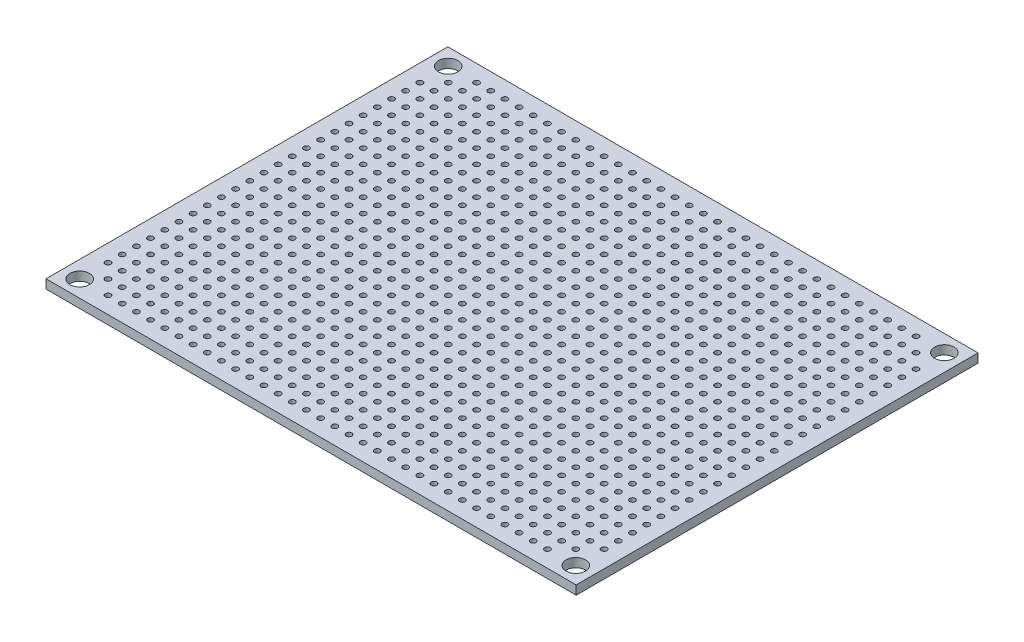
from build123d import *

# Parameters (mm, degrees)
SKETCH_1_W      = 95
SKETCH_1_H      = 72
SKETCH_1_R      = 1.75
SKETCH_1_R_2    = 0.5
EXTRUDE_1_DEPTH = 1.6


with BuildPart() as part:
    # ｽｹｯﾁ1 → ﾎﾞｽ - 押し出し1 (new body)
    with BuildSketch(Plane(origin=(0, 0, 0), x_dir=(1, 0, 0), z_dir=(0, 1, 0))):
        with Locations((47.5, 36)):
            Rectangle(SKETCH_1_W, SKETCH_1_H)
        with Locations((3.05, 69.02)):
            Circle(SKETCH_1_R, mode=Mode.SUBTRACT)
        with Locations((91.95, 69.02)):
            Circle(SKETCH_1_R, mode=Mode.SUBTRACT)
        with Locations((91.95, 2.98)):
            Circle(SKETCH_1_R, mode=Mode.SUBTRACT)
        with Locations((3.05, 2.98)):
            Circle(SKETCH_1_R, mode=Mode.SUBTRACT)
        with Locations((8.13, 69.02)):
            Circle(SKETCH_1_R_2, mode=Mode.SUBTRACT)
        with Locations((10.67, 69.02)):
            Circle(SKETCH_1_R_2, mode=Mode.SUBTRACT)
        with Locations((13.21, 69.02)):
            Circle(SKETCH_1_R_2, mode=Mode.SUBTRACT)
        with Locations((15.75, 69.02)):
            Circle(SKETCH_1_R_2, mode=Mode.SUBTRACT)
        with Locations((18.29, 69.02)):
            Circle(SKETCH_1_R_2, mode=Mode.SUBTRACT)
        with Locations((20.83, 69.02)):
            Circle(SKETCH_1_R_2, mode=Mode.SUBTRACT)
        with Locations((23.37, 69.02)):
            Circle(SKETCH_1_R_2, mode=Mode.SUBTRACT)
        with Locations((25.91, 69.02)):
            Circle(SKETCH_1_R_2, mode=Mode.SUBTRACT)
        with Locations((28.45, 69.02)):
            Circle(SKETCH_1_R_2, mode=Mode.SUBTRACT)
        with Locations((30.99, 69.02)):
            Circle(SKETCH_1_R_2, mode=Mode.SUBTRACT)
        with Locations((33.53, 69.02)):
            Circle(SKETCH_1_R_2, mode=Mode.SUBTRACT)
        with Locations((36.07, 69.02)):
            Circle(SKETCH_1_R_2, mode=Mode.SUBTRACT)
        with Locations((38.61, 69.02)):
            Circle(SKETCH_1_R_2, mode=Mode.SUBTRACT)
        with Locations((41.15, 69.02)):
            Circle(SKETCH_1_R_2, mode=Mode.SUBTRACT)
        with Locations((43.69, 69.02)):
            Circle(SKETCH_1_R_2, mode=Mode.SUBTRACT)
        with Locations((46.23, 69.02)):
            Circle(SKETCH_1_R_2, mode=Mode.SUBTRACT)
        with Locations((48.77, 69.02)):
            Circle(SKETCH_1_R_2, mode=Mode.SUBTRACT)
        with Locations((51.31, 69.02)):
            Circle(SKETCH_1_R_2, mode=Mode.SUBTRACT)
        with Locations((53.85, 69.02)):
            Circle(SKETCH_1_R_2, mode=Mode.SUBTRACT)
        with Locations((56.39, 69.02)):
            Circle(SKETCH_1_R_2, mode=Mode.SUBTRACT)
        with Locations((58.93, 69.02)):
            Circle(SKETCH_1_R_2, mode=Mode.SUBTRACT)
        with Locations((61.47, 69.02)):
            Circle(SKETCH_1_R_2, mode=Mode.SUBTRACT)
        with Locations((64.01, 69.02)):
            Circle(SKETCH_1_R_2, mode=Mode.SUBTRACT)
        with Locations((66.55, 69.02)):
            Circle(SKETCH_1_R_2, mode=Mode.SUBTRACT)
        with Locations((69.09, 69.02)):
            Circle(SKETCH_1_R_2, mode=Mode.SUBTRACT)
        with Locations((71.63, 69.02)):
            Circle(SKETCH_1_R_2, mode=Mode.SUBTRACT)
        with Locations((74.17, 69.02)):
            Circle(SKETCH_1_R_2, mode=Mode.SUBTRACT)
        with Locations((76.71, 69.02)):
            Circle(SKETCH_1_R_2, mode=Mode.SUBTRACT)
        with Locations((79.25, 69.02)):
            Circle(SKETCH_1_R_2, mode=Mode.SUBTRACT)
        with Locations((81.79, 69.02)):
            Circle(SKETCH_1_R_2, mode=Mode.SUBTRACT)
        with Locations((84.33, 69.02)):
            Circle(SKETCH_1_R_2, mode=Mode.SUBTRACT)
        with Locations((86.87, 69.02)):
            Circle(SKETCH_1_R_2, mode=Mode.SUBTRACT)
        with Locations((5.59, 66.48)):
            Circle(SKETCH_1_R_2, mode=Mode.SUBTRACT)
        with Locations((8.13, 66.48)):
            Circle(SKETCH_1_R_2, mode=Mode.SUBTRACT)
        with Locations((10.67, 66.48)):
            Circle(SKETCH_1_R_2, mode=Mode.SUBTRACT)
        with Locations((13.21, 66.48)):
            Circle(SKETCH_1_R_2, mode=Mode.SUBTRACT)
        with Locations((15.75, 66.48)):
            Circle(SKETCH_1_R_2, mode=Mode.SUBTRACT)
        with Locations((18.29, 66.48)):
            Circle(SKETCH_1_R_2, mode=Mode.SUBTRACT)
        with Locations((20.83, 66.48)):
            Circle(SKETCH_1_R_2, mode=Mode.SUBTRACT)
        with Locations((23.37, 66.48)):
            Circle(SKETCH_1_R_2, mode=Mode.SUBTRACT)
        with Locations((25.91, 66.48)):
            Circle(SKETCH_1_R_2, mode=Mode.SUBTRACT)
        with Locations((28.45, 66.48)):
            Circle(SKETCH_1_R_2, mode=Mode.SUBTRACT)
        with Locations((30.99, 66.48)):
            Circle(SKETCH_1_R_2, mode=Mode.SUBTRACT)
        with Locations((33.53, 66.48)):
            Circle(SKETCH_1_R_2, mode=Mode.SUBTRACT)
        with Locations((36.07, 66.48)):
            Circle(SKETCH_1_R_2, mode=Mode.SUBTRACT)
        with Locations((38.61, 66.48)):
            Circle(SKETCH_1_R_2, mode=Mode.SUBTRACT)
        with Locations((41.15, 66.48)):
            Circle(SKETCH_1_R_2, mode=Mode.SUBTRACT)
        with Locations((43.69, 66.48)):
            Circle(SKETCH_1_R_2, mode=Mode.SUBTRACT)
        with Locations((46.23, 66.48)):
            Circle(SKETCH_1_R_2, mode=Mode.SUBTRACT)
        with Locations((48.77, 66.48)):
            Circle(SKETCH_1_R_2, mode=Mode.SUBTRACT)
        with Locations((51.31, 66.48)):
            Circle(SKETCH_1_R_2, mode=Mode.SUBTRACT)
        with Locations((53.85, 66.48)):
            Circle(SKETCH_1_R_2, mode=Mode.SUBTRACT)
        with Locations((56.39, 66.48)):
            Circle(SKETCH_1_R_2, mode=Mode.SUBTRACT)
        with Locations((58.93, 66.48)):
            Circle(SKETCH_1_R_2, mode=Mode.SUBTRACT)
        with Locations((61.47, 66.48)):
            Circle(SKETCH_1_R_2, mode=Mode.SUBTRACT)
        with Locations((64.01, 66.48)):
            Circle(SKETCH_1_R_2, mode=Mode.SUBTRACT)
        with Locations((66.55, 66.48)):
            Circle(SKETCH_1_R_2, mode=Mode.SUBTRACT)
        with Locations((69.09, 66.48)):
            Circle(SKETCH_1_R_2, mode=Mode.SUBTRACT)
        with Locations((71.63, 66.48)):
            Circle(SKETCH_1_R_2, mode=Mode.SUBTRACT)
        with Locations((74.17, 66.48)):
            Circle(SKETCH_1_R_2, mode=Mode.SUBTRACT)
        with Locations((76.71, 66.48)):
            Circle(SKETCH_1_R_2, mode=Mode.SUBTRACT)
        with Locations((79.25, 66.48)):
            Circle(SKETCH_1_R_2, mode=Mode.SUBTRACT)
        with Locations((81.79, 66.48)):
            Circle(SKETCH_1_R_2, mode=Mode.SUBTRACT)
        with Locations((84.33, 66.48)):
            Circle(SKETCH_1_R_2, mode=Mode.SUBTRACT)
        with Locations((86.87, 66.48)):
            Circle(SKETCH_1_R_2, mode=Mode.SUBTRACT)
        with Locations((89.41, 66.48)):
            Circle(SKETCH_1_R_2, mode=Mode.SUBTRACT)
        with Locations((3.05, 63.94)):
            Circle(SKETCH_1_R_2, mode=Mode.SUBTRACT)
        with Locations((5.59, 63.94)):
            Circle(SKETCH_1_R_2, mode=Mode.SUBTRACT)
        with Locations((8.13, 63.94)):
            Circle(SKETCH_1_R_2, mode=Mode.SUBTRACT)
        with Locations((10.67, 63.94)):
            Circle(SKETCH_1_R_2, mode=Mode.SUBTRACT)
        with Locations((13.21, 63.94)):
            Circle(SKETCH_1_R_2, mode=Mode.SUBTRACT)
        with Locations((15.75, 63.94)):
            Circle(SKETCH_1_R_2, mode=Mode.SUBTRACT)
        with Locations((18.29, 63.94)):
            Circle(SKETCH_1_R_2, mode=Mode.SUBTRACT)
        with Locations((20.83, 63.94)):
            Circle(SKETCH_1_R_2, mode=Mode.SUBTRACT)
        with Locations((23.37, 63.94)):
            Circle(SKETCH_1_R_2, mode=Mode.SUBTRACT)
        with Locations((25.91, 63.94)):
            Circle(SKETCH_1_R_2, mode=Mode.SUBTRACT)
        with Locations((28.45, 63.94)):
            Circle(SKETCH_1_R_2, mode=Mode.SUBTRACT)
        with Locations((30.99, 63.94)):
            Circle(SKETCH_1_R_2, mode=Mode.SUBTRACT)
        with Locations((33.53, 63.94)):
            Circle(SKETCH_1_R_2, mode=Mode.SUBTRACT)
        with Locations((36.07, 63.94)):
            Circle(SKETCH_1_R_2, mode=Mode.SUBTRACT)
        with Locations((38.61, 63.94)):
            Circle(SKETCH_1_R_2, mode=Mode.SUBTRACT)
        with Locations((41.15, 63.94)):
            Circle(SKETCH_1_R_2, mode=Mode.SUBTRACT)
        with Locations((43.69, 63.94)):
            Circle(SKETCH_1_R_2, mode=Mode.SUBTRACT)
        with Locations((46.23, 63.94)):
            Circle(SKETCH_1_R_2, mode=Mode.SUBTRACT)
        with Locations((48.77, 63.94)):
            Circle(SKETCH_1_R_2, mode=Mode.SUBTRACT)
        with Locations((51.31, 63.94)):
            Circle(SKETCH_1_R_2, mode=Mode.SUBTRACT)
        with Locations((53.85, 63.94)):
            Circle(SKETCH_1_R_2, mode=Mode.SUBTRACT)
        with Locations((56.39, 63.94)):
            Circle(SKETCH_1_R_2, mode=Mode.SUBTRACT)
        with Locations((58.93, 63.94)):
            Circle(SKETCH_1_R_2, mode=Mode.SUBTRACT)
        with Locations((61.47, 63.94)):
            Circle(SKETCH_1_R_2, mode=Mode.SUBTRACT)
        with Locations((64.01, 63.94)):
            Circle(SKETCH_1_R_2, mode=Mode.SUBTRACT)
        with Locations((66.55, 63.94)):
            Circle(SKETCH_1_R_2, mode=Mode.SUBTRACT)
        with Locations((69.09, 63.94)):
            Circle(SKETCH_1_R_2, mode=Mode.SUBTRACT)
        with Locations((71.63, 63.94)):
            Circle(SKETCH_1_R_2, mode=Mode.SUBTRACT)
        with Locations((74.17, 63.94)):
            Circle(SKETCH_1_R_2, mode=Mode.SUBTRACT)
        with Locations((76.71, 63.94)):
            Circle(SKETCH_1_R_2, mode=Mode.SUBTRACT)
        with Locations((79.25, 63.94)):
            Circle(SKETCH_1_R_2, mode=Mode.SUBTRACT)
        with Locations((81.79, 63.94)):
            Circle(SKETCH_1_R_2, mode=Mode.SUBTRACT)
        with Locations((84.33, 63.94)):
            Circle(SKETCH_1_R_2, mode=Mode.SUBTRACT)
        with Locations((86.87, 63.94)):
            Circle(SKETCH_1_R_2, mode=Mode.SUBTRACT)
        with Locations((89.41, 63.94)):
            Circle(SKETCH_1_R_2, mode=Mode.SUBTRACT)
        with Locations((91.95, 63.94)):
            Circle(SKETCH_1_R_2, mode=Mode.SUBTRACT)
        with Locations((3.05, 61.4)):
            Circle(SKETCH_1_R_2, mode=Mode.SUBTRACT)
        with Locations((5.59, 61.4)):
            Circle(SKETCH_1_R_2, mode=Mode.SUBTRACT)
        with Locations((8.13, 61.4)):
            Circle(SKETCH_1_R_2, mode=Mode.SUBTRACT)
        with Locations((10.67, 61.4)):
            Circle(SKETCH_1_R_2, mode=Mode.SUBTRACT)
        with Locations((13.21, 61.4)):
            Circle(SKETCH_1_R_2, mode=Mode.SUBTRACT)
        with Locations((15.75, 61.4)):
            Circle(SKETCH_1_R_2, mode=Mode.SUBTRACT)
        with Locations((18.29, 61.4)):
            Circle(SKETCH_1_R_2, mode=Mode.SUBTRACT)
        with Locations((20.83, 61.4)):
            Circle(SKETCH_1_R_2, mode=Mode.SUBTRACT)
        with Locations((23.37, 61.4)):
            Circle(SKETCH_1_R_2, mode=Mode.SUBTRACT)
        with Locations((25.91, 61.4)):
            Circle(SKETCH_1_R_2, mode=Mode.SUBTRACT)
        with Locations((28.45, 61.4)):
            Circle(SKETCH_1_R_2, mode=Mode.SUBTRACT)
        with Locations((30.99, 61.4)):
            Circle(SKETCH_1_R_2, mode=Mode.SUBTRACT)
        with Locations((33.53, 61.4)):
            Circle(SKETCH_1_R_2, mode=Mode.SUBTRACT)
        with Locations((36.07, 61.4)):
            Circle(SKETCH_1_R_2, mode=Mode.SUBTRACT)
        with Locations((38.61, 61.4)):
            Circle(SKETCH_1_R_2, mode=Mode.SUBTRACT)
        with Locations((41.15, 61.4)):
            Circle(SKETCH_1_R_2, mode=Mode.SUBTRACT)
        with Locations((43.69, 61.4)):
            Circle(SKETCH_1_R_2, mode=Mode.SUBTRACT)
        with Locations((46.23, 61.4)):
            Circle(SKETCH_1_R_2, mode=Mode.SUBTRACT)
        with Locations((48.77, 61.4)):
            Circle(SKETCH_1_R_2, mode=Mode.SUBTRACT)
        with Locations((51.31, 61.4)):
            Circle(SKETCH_1_R_2, mode=Mode.SUBTRACT)
        with Locations((53.85, 61.4)):
            Circle(SKETCH_1_R_2, mode=Mode.SUBTRACT)
        with Locations((56.39, 61.4)):
            Circle(SKETCH_1_R_2, mode=Mode.SUBTRACT)
        with Locations((58.93, 61.4)):
            Circle(SKETCH_1_R_2, mode=Mode.SUBTRACT)
        with Locations((61.47, 61.4)):
            Circle(SKETCH_1_R_2, mode=Mode.SUBTRACT)
        with Locations((64.01, 61.4)):
            Circle(SKETCH_1_R_2, mode=Mode.SUBTRACT)
        with Locations((66.55, 61.4)):
            Circle(SKETCH_1_R_2, mode=Mode.SUBTRACT)
        with Locations((69.09, 61.4)):
            Circle(SKETCH_1_R_2, mode=Mode.SUBTRACT)
        with Locations((71.63, 61.4)):
            Circle(SKETCH_1_R_2, mode=Mode.SUBTRACT)
        with Locations((74.17, 61.4)):
            Circle(SKETCH_1_R_2, mode=Mode.SUBTRACT)
        with Locations((76.71, 61.4)):
            Circle(SKETCH_1_R_2, mode=Mode.SUBTRACT)
        with Locations((79.25, 61.4)):
            Circle(SKETCH_1_R_2, mode=Mode.SUBTRACT)
        with Locations((81.79, 61.4)):
            Circle(SKETCH_1_R_2, mode=Mode.SUBTRACT)
        with Locations((84.33, 61.4)):
            Circle(SKETCH_1_R_2, mode=Mode.SUBTRACT)
        with Locations((86.87, 61.4)):
            Circle(SKETCH_1_R_2, mode=Mode.SUBTRACT)
        with Locations((89.41, 61.4)):
            Circle(SKETCH_1_R_2, mode=Mode.SUBTRACT)
        with Locations((91.95, 61.4)):
            Circle(SKETCH_1_R_2, mode=Mode.SUBTRACT)
        with Locations((3.05, 58.86)):
            Circle(SKETCH_1_R_2, mode=Mode.SUBTRACT)
        with Locations((5.59, 58.86)):
            Circle(SKETCH_1_R_2, mode=Mode.SUBTRACT)
        with Locations((8.13, 58.86)):
            Circle(SKETCH_1_R_2, mode=Mode.SUBTRACT)
        with Locations((10.67, 58.86)):
            Circle(SKETCH_1_R_2, mode=Mode.SUBTRACT)
        with Locations((13.21, 58.86)):
            Circle(SKETCH_1_R_2, mode=Mode.SUBTRACT)
        with Locations((15.75, 58.86)):
            Circle(SKETCH_1_R_2, mode=Mode.SUBTRACT)
        with Locations((18.29, 58.86)):
            Circle(SKETCH_1_R_2, mode=Mode.SUBTRACT)
        with Locations((20.83, 58.86)):
            Circle(SKETCH_1_R_2, mode=Mode.SUBTRACT)
        with Locations((23.37, 58.86)):
            Circle(SKETCH_1_R_2, mode=Mode.SUBTRACT)
        with Locations((25.91, 58.86)):
            Circle(SKETCH_1_R_2, mode=Mode.SUBTRACT)
        with Locations((28.45, 58.86)):
            Circle(SKETCH_1_R_2, mode=Mode.SUBTRACT)
        with Locations((30.99, 58.86)):
            Circle(SKETCH_1_R_2, mode=Mode.SUBTRACT)
        with Locations((33.53, 58.86)):
            Circle(SKETCH_1_R_2, mode=Mode.SUBTRACT)
        with Locations((36.07, 58.86)):
            Circle(SKETCH_1_R_2, mode=Mode.SUBTRACT)
        with Locations((38.61, 58.86)):
            Circle(SKETCH_1_R_2, mode=Mode.SUBTRACT)
        with Locations((41.15, 58.86)):
            Circle(SKETCH_1_R_2, mode=Mode.SUBTRACT)
        with Locations((43.69, 58.86)):
            Circle(SKETCH_1_R_2, mode=Mode.SUBTRACT)
        with Locations((46.23, 58.86)):
            Circle(SKETCH_1_R_2, mode=Mode.SUBTRACT)
        with Locations((48.77, 58.86)):
            Circle(SKETCH_1_R_2, mode=Mode.SUBTRACT)
        with Locations((51.31, 58.86)):
            Circle(SKETCH_1_R_2, mode=Mode.SUBTRACT)
        with Locations((53.85, 58.86)):
            Circle(SKETCH_1_R_2, mode=Mode.SUBTRACT)
        with Locations((56.39, 58.86)):
            Circle(SKETCH_1_R_2, mode=Mode.SUBTRACT)
        with Locations((58.93, 58.86)):
            Circle(SKETCH_1_R_2, mode=Mode.SUBTRACT)
        with Locations((61.47, 58.86)):
            Circle(SKETCH_1_R_2, mode=Mode.SUBTRACT)
        with Locations((64.01, 58.86)):
            Circle(SKETCH_1_R_2, mode=Mode.SUBTRACT)
        with Locations((66.55, 58.86)):
            Circle(SKETCH_1_R_2, mode=Mode.SUBTRACT)
        with Locations((69.09, 58.86)):
            Circle(SKETCH_1_R_2, mode=Mode.SUBTRACT)
        with Locations((71.63, 58.86)):
            Circle(SKETCH_1_R_2, mode=Mode.SUBTRACT)
        with Locations((74.17, 58.86)):
            Circle(SKETCH_1_R_2, mode=Mode.SUBTRACT)
        with Locations((76.71, 58.86)):
            Circle(SKETCH_1_R_2, mode=Mode.SUBTRACT)
        with Locations((79.25, 58.86)):
            Circle(SKETCH_1_R_2, mode=Mode.SUBTRACT)
        with Locations((81.79, 58.86)):
            Circle(SKETCH_1_R_2, mode=Mode.SUBTRACT)
        with Locations((84.33, 58.86)):
            Circle(SKETCH_1_R_2, mode=Mode.SUBTRACT)
        with Locations((86.87, 58.86)):
            Circle(SKETCH_1_R_2, mode=Mode.SUBTRACT)
        with Locations((89.41, 58.86)):
            Circle(SKETCH_1_R_2, mode=Mode.SUBTRACT)
        with Locations((91.95, 58.86)):
            Circle(SKETCH_1_R_2, mode=Mode.SUBTRACT)
        with Locations((3.05, 56.32)):
            Circle(SKETCH_1_R_2, mode=Mode.SUBTRACT)
        with Locations((5.59, 56.32)):
            Circle(SKETCH_1_R_2, mode=Mode.SUBTRACT)
        with Locations((8.13, 56.32)):
            Circle(SKETCH_1_R_2, mode=Mode.SUBTRACT)
        with Locations((10.67, 56.32)):
            Circle(SKETCH_1_R_2, mode=Mode.SUBTRACT)
        with Locations((13.21, 56.32)):
            Circle(SKETCH_1_R_2, mode=Mode.SUBTRACT)
        with Locations((15.75, 56.32)):
            Circle(SKETCH_1_R_2, mode=Mode.SUBTRACT)
        with Locations((18.29, 56.32)):
            Circle(SKETCH_1_R_2, mode=Mode.SUBTRACT)
        with Locations((20.83, 56.32)):
            Circle(SKETCH_1_R_2, mode=Mode.SUBTRACT)
        with Locations((23.37, 56.32)):
            Circle(SKETCH_1_R_2, mode=Mode.SUBTRACT)
        with Locations((25.91, 56.32)):
            Circle(SKETCH_1_R_2, mode=Mode.SUBTRACT)
        with Locations((28.45, 56.32)):
            Circle(SKETCH_1_R_2, mode=Mode.SUBTRACT)
        with Locations((30.99, 56.32)):
            Circle(SKETCH_1_R_2, mode=Mode.SUBTRACT)
        with Locations((33.53, 56.32)):
            Circle(SKETCH_1_R_2, mode=Mode.SUBTRACT)
        with Locations((36.07, 56.32)):
            Circle(SKETCH_1_R_2, mode=Mode.SUBTRACT)
        with Locations((38.61, 56.32)):
            Circle(SKETCH_1_R_2, mode=Mode.SUBTRACT)
        with Locations((41.15, 56.32)):
            Circle(SKETCH_1_R_2, mode=Mode.SUBTRACT)
        with Locations((43.69, 56.32)):
            Circle(SKETCH_1_R_2, mode=Mode.SUBTRACT)
        with Locations((46.23, 56.32)):
            Circle(SKETCH_1_R_2, mode=Mode.SUBTRACT)
        with Locations((48.77, 56.32)):
            Circle(SKETCH_1_R_2, mode=Mode.SUBTRACT)
        with Locations((51.31, 56.32)):
            Circle(SKETCH_1_R_2, mode=Mode.SUBTRACT)
        with Locations((53.85, 56.32)):
            Circle(SKETCH_1_R_2, mode=Mode.SUBTRACT)
        with Locations((56.39, 56.32)):
            Circle(SKETCH_1_R_2, mode=Mode.SUBTRACT)
        with Locations((58.93, 56.32)):
            Circle(SKETCH_1_R_2, mode=Mode.SUBTRACT)
        with Locations((61.47, 56.32)):
            Circle(SKETCH_1_R_2, mode=Mode.SUBTRACT)
        with Locations((64.01, 56.32)):
            Circle(SKETCH_1_R_2, mode=Mode.SUBTRACT)
        with Locations((66.55, 56.32)):
            Circle(SKETCH_1_R_2, mode=Mode.SUBTRACT)
        with Locations((69.09, 56.32)):
            Circle(SKETCH_1_R_2, mode=Mode.SUBTRACT)
        with Locations((71.63, 56.32)):
            Circle(SKETCH_1_R_2, mode=Mode.SUBTRACT)
        with Locations((74.17, 56.32)):
            Circle(SKETCH_1_R_2, mode=Mode.SUBTRACT)
        with Locations((76.71, 56.32)):
            Circle(SKETCH_1_R_2, mode=Mode.SUBTRACT)
        with Locations((79.25, 56.32)):
            Circle(SKETCH_1_R_2, mode=Mode.SUBTRACT)
        with Locations((81.79, 56.32)):
            Circle(SKETCH_1_R_2, mode=Mode.SUBTRACT)
        with Locations((84.33, 56.32)):
            Circle(SKETCH_1_R_2, mode=Mode.SUBTRACT)
        with Locations((86.87, 56.32)):
            Circle(SKETCH_1_R_2, mode=Mode.SUBTRACT)
        with Locations((89.41, 56.32)):
            Circle(SKETCH_1_R_2, mode=Mode.SUBTRACT)
        with Locations((91.95, 56.32)):
            Circle(SKETCH_1_R_2, mode=Mode.SUBTRACT)
        with Locations((3.05, 53.78)):
            Circle(SKETCH_1_R_2, mode=Mode.SUBTRACT)
        with Locations((5.59, 53.78)):
            Circle(SKETCH_1_R_2, mode=Mode.SUBTRACT)
        with Locations((8.13, 53.78)):
            Circle(SKETCH_1_R_2, mode=Mode.SUBTRACT)
        with Locations((10.67, 53.78)):
            Circle(SKETCH_1_R_2, mode=Mode.SUBTRACT)
        with Locations((13.21, 53.78)):
            Circle(SKETCH_1_R_2, mode=Mode.SUBTRACT)
        with Locations((15.75, 53.78)):
            Circle(SKETCH_1_R_2, mode=Mode.SUBTRACT)
        with Locations((18.29, 53.78)):
            Circle(SKETCH_1_R_2, mode=Mode.SUBTRACT)
        with Locations((20.83, 53.78)):
            Circle(SKETCH_1_R_2, mode=Mode.SUBTRACT)
        with Locations((23.37, 53.78)):
            Circle(SKETCH_1_R_2, mode=Mode.SUBTRACT)
        with Locations((25.91, 53.78)):
            Circle(SKETCH_1_R_2, mode=Mode.SUBTRACT)
        with Locations((28.45, 53.78)):
            Circle(SKETCH_1_R_2, mode=Mode.SUBTRACT)
        with Locations((30.99, 53.78)):
            Circle(SKETCH_1_R_2, mode=Mode.SUBTRACT)
        with Locations((33.53, 53.78)):
            Circle(SKETCH_1_R_2, mode=Mode.SUBTRACT)
        with Locations((36.07, 53.78)):
            Circle(SKETCH_1_R_2, mode=Mode.SUBTRACT)
        with Locations((38.61, 53.78)):
            Circle(SKETCH_1_R_2, mode=Mode.SUBTRACT)
        with Locations((41.15, 53.78)):
            Circle(SKETCH_1_R_2, mode=Mode.SUBTRACT)
        with Locations((43.69, 53.78)):
            Circle(SKETCH_1_R_2, mode=Mode.SUBTRACT)
        with Locations((46.23, 53.78)):
            Circle(SKETCH_1_R_2, mode=Mode.SUBTRACT)
        with Locations((48.77, 53.78)):
            Circle(SKETCH_1_R_2, mode=Mode.SUBTRACT)
        with Locations((51.31, 53.78)):
            Circle(SKETCH_1_R_2, mode=Mode.SUBTRACT)
        with Locations((53.85, 53.78)):
            Circle(SKETCH_1_R_2, mode=Mode.SUBTRACT)
        with Locations((56.39, 53.78)):
            Circle(SKETCH_1_R_2, mode=Mode.SUBTRACT)
        with Locations((58.93, 53.78)):
            Circle(SKETCH_1_R_2, mode=Mode.SUBTRACT)
        with Locations((61.47, 53.78)):
            Circle(SKETCH_1_R_2, mode=Mode.SUBTRACT)
        with Locations((64.01, 53.78)):
            Circle(SKETCH_1_R_2, mode=Mode.SUBTRACT)
        with Locations((66.55, 53.78)):
            Circle(SKETCH_1_R_2, mode=Mode.SUBTRACT)
        with Locations((69.09, 53.78)):
            Circle(SKETCH_1_R_2, mode=Mode.SUBTRACT)
        with Locations((71.63, 53.78)):
            Circle(SKETCH_1_R_2, mode=Mode.SUBTRACT)
        with Locations((74.17, 53.78)):
            Circle(SKETCH_1_R_2, mode=Mode.SUBTRACT)
        with Locations((76.71, 53.78)):
            Circle(SKETCH_1_R_2, mode=Mode.SUBTRACT)
        with Locations((79.25, 53.78)):
            Circle(SKETCH_1_R_2, mode=Mode.SUBTRACT)
        with Locations((81.79, 53.78)):
            Circle(SKETCH_1_R_2, mode=Mode.SUBTRACT)
        with Locations((84.33, 53.78)):
            Circle(SKETCH_1_R_2, mode=Mode.SUBTRACT)
        with Locations((86.87, 53.78)):
            Circle(SKETCH_1_R_2, mode=Mode.SUBTRACT)
        with Locations((89.41, 53.78)):
            Circle(SKETCH_1_R_2, mode=Mode.SUBTRACT)
        with Locations((91.95, 53.78)):
            Circle(SKETCH_1_R_2, mode=Mode.SUBTRACT)
        with Locations((3.05, 51.24)):
            Circle(SKETCH_1_R_2, mode=Mode.SUBTRACT)
        with Locations((5.59, 51.24)):
            Circle(SKETCH_1_R_2, mode=Mode.SUBTRACT)
        with Locations((8.13, 51.24)):
            Circle(SKETCH_1_R_2, mode=Mode.SUBTRACT)
        with Locations((10.67, 51.24)):
            Circle(SKETCH_1_R_2, mode=Mode.SUBTRACT)
        with Locations((13.21, 51.24)):
            Circle(SKETCH_1_R_2, mode=Mode.SUBTRACT)
        with Locations((15.75, 51.24)):
            Circle(SKETCH_1_R_2, mode=Mode.SUBTRACT)
        with Locations((18.29, 51.24)):
            Circle(SKETCH_1_R_2, mode=Mode.SUBTRACT)
        with Locations((20.83, 51.24)):
            Circle(SKETCH_1_R_2, mode=Mode.SUBTRACT)
        with Locations((23.37, 51.24)):
            Circle(SKETCH_1_R_2, mode=Mode.SUBTRACT)
        with Locations((25.91, 51.24)):
            Circle(SKETCH_1_R_2, mode=Mode.SUBTRACT)
        with Locations((28.45, 51.24)):
            Circle(SKETCH_1_R_2, mode=Mode.SUBTRACT)
        with Locations((30.99, 51.24)):
            Circle(SKETCH_1_R_2, mode=Mode.SUBTRACT)
        with Locations((33.53, 51.24)):
            Circle(SKETCH_1_R_2, mode=Mode.SUBTRACT)
        with Locations((36.07, 51.24)):
            Circle(SKETCH_1_R_2, mode=Mode.SUBTRACT)
        with Locations((38.61, 51.24)):
            Circle(SKETCH_1_R_2, mode=Mode.SUBTRACT)
        with Locations((41.15, 51.24)):
            Circle(SKETCH_1_R_2, mode=Mode.SUBTRACT)
        with Locations((43.69, 51.24)):
            Circle(SKETCH_1_R_2, mode=Mode.SUBTRACT)
        with Locations((46.23, 51.24)):
            Circle(SKETCH_1_R_2, mode=Mode.SUBTRACT)
        with Locations((48.77, 51.24)):
            Circle(SKETCH_1_R_2, mode=Mode.SUBTRACT)
        with Locations((51.31, 51.24)):
            Circle(SKETCH_1_R_2, mode=Mode.SUBTRACT)
        with Locations((53.85, 51.24)):
            Circle(SKETCH_1_R_2, mode=Mode.SUBTRACT)
        with Locations((56.39, 51.24)):
            Circle(SKETCH_1_R_2, mode=Mode.SUBTRACT)
        with Locations((58.93, 51.24)):
            Circle(SKETCH_1_R_2, mode=Mode.SUBTRACT)
        with Locations((61.47, 51.24)):
            Circle(SKETCH_1_R_2, mode=Mode.SUBTRACT)
        with Locations((64.01, 51.24)):
            Circle(SKETCH_1_R_2, mode=Mode.SUBTRACT)
        with Locations((66.55, 51.24)):
            Circle(SKETCH_1_R_2, mode=Mode.SUBTRACT)
        with Locations((69.09, 51.24)):
            Circle(SKETCH_1_R_2, mode=Mode.SUBTRACT)
        with Locations((71.63, 51.24)):
            Circle(SKETCH_1_R_2, mode=Mode.SUBTRACT)
        with Locations((74.17, 51.24)):
            Circle(SKETCH_1_R_2, mode=Mode.SUBTRACT)
        with Locations((76.71, 51.24)):
            Circle(SKETCH_1_R_2, mode=Mode.SUBTRACT)
        with Locations((79.25, 51.24)):
            Circle(SKETCH_1_R_2, mode=Mode.SUBTRACT)
        with Locations((81.79, 51.24)):
            Circle(SKETCH_1_R_2, mode=Mode.SUBTRACT)
        with Locations((84.33, 51.24)):
            Circle(SKETCH_1_R_2, mode=Mode.SUBTRACT)
        with Locations((86.87, 51.24)):
            Circle(SKETCH_1_R_2, mode=Mode.SUBTRACT)
        with Locations((89.41, 51.24)):
            Circle(SKETCH_1_R_2, mode=Mode.SUBTRACT)
        with Locations((91.95, 51.24)):
            Circle(SKETCH_1_R_2, mode=Mode.SUBTRACT)
        with Locations((3.05, 48.7)):
            Circle(SKETCH_1_R_2, mode=Mode.SUBTRACT)
        with Locations((5.59, 48.7)):
            Circle(SKETCH_1_R_2, mode=Mode.SUBTRACT)
        with Locations((8.13, 48.7)):
            Circle(SKETCH_1_R_2, mode=Mode.SUBTRACT)
        with Locations((10.67, 48.7)):
            Circle(SKETCH_1_R_2, mode=Mode.SUBTRACT)
        with Locations((13.21, 48.7)):
            Circle(SKETCH_1_R_2, mode=Mode.SUBTRACT)
        with Locations((15.75, 48.7)):
            Circle(SKETCH_1_R_2, mode=Mode.SUBTRACT)
        with Locations((18.29, 48.7)):
            Circle(SKETCH_1_R_2, mode=Mode.SUBTRACT)
        with Locations((20.83, 48.7)):
            Circle(SKETCH_1_R_2, mode=Mode.SUBTRACT)
        with Locations((23.37, 48.7)):
            Circle(SKETCH_1_R_2, mode=Mode.SUBTRACT)
        with Locations((25.91, 48.7)):
            Circle(SKETCH_1_R_2, mode=Mode.SUBTRACT)
        with Locations((28.45, 48.7)):
            Circle(SKETCH_1_R_2, mode=Mode.SUBTRACT)
        with Locations((30.99, 48.7)):
            Circle(SKETCH_1_R_2, mode=Mode.SUBTRACT)
        with Locations((33.53, 48.7)):
            Circle(SKETCH_1_R_2, mode=Mode.SUBTRACT)
        with Locations((36.07, 48.7)):
            Circle(SKETCH_1_R_2, mode=Mode.SUBTRACT)
        with Locations((38.61, 48.7)):
            Circle(SKETCH_1_R_2, mode=Mode.SUBTRACT)
        with Locations((41.15, 48.7)):
            Circle(SKETCH_1_R_2, mode=Mode.SUBTRACT)
        with Locations((43.69, 48.7)):
            Circle(SKETCH_1_R_2, mode=Mode.SUBTRACT)
        with Locations((46.23, 48.7)):
            Circle(SKETCH_1_R_2, mode=Mode.SUBTRACT)
        with Locations((48.77, 48.7)):
            Circle(SKETCH_1_R_2, mode=Mode.SUBTRACT)
        with Locations((51.31, 48.7)):
            Circle(SKETCH_1_R_2, mode=Mode.SUBTRACT)
        with Locations((53.85, 48.7)):
            Circle(SKETCH_1_R_2, mode=Mode.SUBTRACT)
        with Locations((56.39, 48.7)):
            Circle(SKETCH_1_R_2, mode=Mode.SUBTRACT)
        with Locations((58.93, 48.7)):
            Circle(SKETCH_1_R_2, mode=Mode.SUBTRACT)
        with Locations((61.47, 48.7)):
            Circle(SKETCH_1_R_2, mode=Mode.SUBTRACT)
        with Locations((64.01, 48.7)):
            Circle(SKETCH_1_R_2, mode=Mode.SUBTRACT)
        with Locations((66.55, 48.7)):
            Circle(SKETCH_1_R_2, mode=Mode.SUBTRACT)
        with Locations((69.09, 48.7)):
            Circle(SKETCH_1_R_2, mode=Mode.SUBTRACT)
        with Locations((71.63, 48.7)):
            Circle(SKETCH_1_R_2, mode=Mode.SUBTRACT)
        with Locations((74.17, 48.7)):
            Circle(SKETCH_1_R_2, mode=Mode.SUBTRACT)
        with Locations((76.71, 48.7)):
            Circle(SKETCH_1_R_2, mode=Mode.SUBTRACT)
        with Locations((79.25, 48.7)):
            Circle(SKETCH_1_R_2, mode=Mode.SUBTRACT)
        with Locations((81.79, 48.7)):
            Circle(SKETCH_1_R_2, mode=Mode.SUBTRACT)
        with Locations((84.33, 48.7)):
            Circle(SKETCH_1_R_2, mode=Mode.SUBTRACT)
        with Locations((86.87, 48.7)):
            Circle(SKETCH_1_R_2, mode=Mode.SUBTRACT)
        with Locations((89.41, 48.7)):
            Circle(SKETCH_1_R_2, mode=Mode.SUBTRACT)
        with Locations((91.95, 48.7)):
            Circle(SKETCH_1_R_2, mode=Mode.SUBTRACT)
        with Locations((3.05, 46.16)):
            Circle(SKETCH_1_R_2, mode=Mode.SUBTRACT)
        with Locations((5.59, 46.16)):
            Circle(SKETCH_1_R_2, mode=Mode.SUBTRACT)
        with Locations((8.13, 46.16)):
            Circle(SKETCH_1_R_2, mode=Mode.SUBTRACT)
        with Locations((10.67, 46.16)):
            Circle(SKETCH_1_R_2, mode=Mode.SUBTRACT)
        with Locations((13.21, 46.16)):
            Circle(SKETCH_1_R_2, mode=Mode.SUBTRACT)
        with Locations((15.75, 46.16)):
            Circle(SKETCH_1_R_2, mode=Mode.SUBTRACT)
        with Locations((18.29, 46.16)):
            Circle(SKETCH_1_R_2, mode=Mode.SUBTRACT)
        with Locations((20.83, 46.16)):
            Circle(SKETCH_1_R_2, mode=Mode.SUBTRACT)
        with Locations((23.37, 46.16)):
            Circle(SKETCH_1_R_2, mode=Mode.SUBTRACT)
        with Locations((25.91, 46.16)):
            Circle(SKETCH_1_R_2, mode=Mode.SUBTRACT)
        with Locations((28.45, 46.16)):
            Circle(SKETCH_1_R_2, mode=Mode.SUBTRACT)
        with Locations((30.99, 46.16)):
            Circle(SKETCH_1_R_2, mode=Mode.SUBTRACT)
        with Locations((33.53, 46.16)):
            Circle(SKETCH_1_R_2, mode=Mode.SUBTRACT)
        with Locations((36.07, 46.16)):
            Circle(SKETCH_1_R_2, mode=Mode.SUBTRACT)
        with Locations((38.61, 46.16)):
            Circle(SKETCH_1_R_2, mode=Mode.SUBTRACT)
        with Locations((41.15, 46.16)):
            Circle(SKETCH_1_R_2, mode=Mode.SUBTRACT)
        with Locations((43.69, 46.16)):
            Circle(SKETCH_1_R_2, mode=Mode.SUBTRACT)
        with Locations((46.23, 46.16)):
            Circle(SKETCH_1_R_2, mode=Mode.SUBTRACT)
        with Locations((48.77, 46.16)):
            Circle(SKETCH_1_R_2, mode=Mode.SUBTRACT)
        with Locations((51.31, 46.16)):
            Circle(SKETCH_1_R_2, mode=Mode.SUBTRACT)
        with Locations((53.85, 46.16)):
            Circle(SKETCH_1_R_2, mode=Mode.SUBTRACT)
        with Locations((56.39, 46.16)):
            Circle(SKETCH_1_R_2, mode=Mode.SUBTRACT)
        with Locations((58.93, 46.16)):
            Circle(SKETCH_1_R_2, mode=Mode.SUBTRACT)
        with Locations((61.47, 46.16)):
            Circle(SKETCH_1_R_2, mode=Mode.SUBTRACT)
        with Locations((64.01, 46.16)):
            Circle(SKETCH_1_R_2, mode=Mode.SUBTRACT)
        with Locations((66.55, 46.16)):
            Circle(SKETCH_1_R_2, mode=Mode.SUBTRACT)
        with Locations((69.09, 46.16)):
            Circle(SKETCH_1_R_2, mode=Mode.SUBTRACT)
        with Locations((71.63, 46.16)):
            Circle(SKETCH_1_R_2, mode=Mode.SUBTRACT)
        with Locations((74.17, 46.16)):
            Circle(SKETCH_1_R_2, mode=Mode.SUBTRACT)
        with Locations((76.71, 46.16)):
            Circle(SKETCH_1_R_2, mode=Mode.SUBTRACT)
        with Locations((79.25, 46.16)):
            Circle(SKETCH_1_R_2, mode=Mode.SUBTRACT)
        with Locations((81.79, 46.16)):
            Circle(SKETCH_1_R_2, mode=Mode.SUBTRACT)
        with Locations((84.33, 46.16)):
            Circle(SKETCH_1_R_2, mode=Mode.SUBTRACT)
        with Locations((86.87, 46.16)):
            Circle(SKETCH_1_R_2, mode=Mode.SUBTRACT)
        with Locations((89.41, 46.16)):
            Circle(SKETCH_1_R_2, mode=Mode.SUBTRACT)
        with Locations((91.95, 46.16)):
            Circle(SKETCH_1_R_2, mode=Mode.SUBTRACT)
        with Locations((3.05, 43.62)):
            Circle(SKETCH_1_R_2, mode=Mode.SUBTRACT)
        with Locations((5.59, 43.62)):
            Circle(SKETCH_1_R_2, mode=Mode.SUBTRACT)
        with Locations((8.13, 43.62)):
            Circle(SKETCH_1_R_2, mode=Mode.SUBTRACT)
        with Locations((10.67, 43.62)):
            Circle(SKETCH_1_R_2, mode=Mode.SUBTRACT)
        with Locations((13.21, 43.62)):
            Circle(SKETCH_1_R_2, mode=Mode.SUBTRACT)
        with Locations((15.75, 43.62)):
            Circle(SKETCH_1_R_2, mode=Mode.SUBTRACT)
        with Locations((18.29, 43.62)):
            Circle(SKETCH_1_R_2, mode=Mode.SUBTRACT)
        with Locations((20.83, 43.62)):
            Circle(SKETCH_1_R_2, mode=Mode.SUBTRACT)
        with Locations((23.37, 43.62)):
            Circle(SKETCH_1_R_2, mode=Mode.SUBTRACT)
        with Locations((25.91, 43.62)):
            Circle(SKETCH_1_R_2, mode=Mode.SUBTRACT)
        with Locations((28.45, 43.62)):
            Circle(SKETCH_1_R_2, mode=Mode.SUBTRACT)
        with Locations((30.99, 43.62)):
            Circle(SKETCH_1_R_2, mode=Mode.SUBTRACT)
        with Locations((33.53, 43.62)):
            Circle(SKETCH_1_R_2, mode=Mode.SUBTRACT)
        with Locations((36.07, 43.62)):
            Circle(SKETCH_1_R_2, mode=Mode.SUBTRACT)
        with Locations((38.61, 43.62)):
            Circle(SKETCH_1_R_2, mode=Mode.SUBTRACT)
        with Locations((41.15, 43.62)):
            Circle(SKETCH_1_R_2, mode=Mode.SUBTRACT)
        with Locations((43.69, 43.62)):
            Circle(SKETCH_1_R_2, mode=Mode.SUBTRACT)
        with Locations((46.23, 43.62)):
            Circle(SKETCH_1_R_2, mode=Mode.SUBTRACT)
        with Locations((48.77, 43.62)):
            Circle(SKETCH_1_R_2, mode=Mode.SUBTRACT)
        with Locations((51.31, 43.62)):
            Circle(SKETCH_1_R_2, mode=Mode.SUBTRACT)
        with Locations((53.85, 43.62)):
            Circle(SKETCH_1_R_2, mode=Mode.SUBTRACT)
        with Locations((56.39, 43.62)):
            Circle(SKETCH_1_R_2, mode=Mode.SUBTRACT)
        with Locations((58.93, 43.62)):
            Circle(SKETCH_1_R_2, mode=Mode.SUBTRACT)
        with Locations((61.47, 43.62)):
            Circle(SKETCH_1_R_2, mode=Mode.SUBTRACT)
        with Locations((64.01, 43.62)):
            Circle(SKETCH_1_R_2, mode=Mode.SUBTRACT)
        with Locations((66.55, 43.62)):
            Circle(SKETCH_1_R_2, mode=Mode.SUBTRACT)
        with Locations((69.09, 43.62)):
            Circle(SKETCH_1_R_2, mode=Mode.SUBTRACT)
        with Locations((71.63, 43.62)):
            Circle(SKETCH_1_R_2, mode=Mode.SUBTRACT)
        with Locations((74.17, 43.62)):
            Circle(SKETCH_1_R_2, mode=Mode.SUBTRACT)
        with Locations((76.71, 43.62)):
            Circle(SKETCH_1_R_2, mode=Mode.SUBTRACT)
        with Locations((79.25, 43.62)):
            Circle(SKETCH_1_R_2, mode=Mode.SUBTRACT)
        with Locations((81.79, 43.62)):
            Circle(SKETCH_1_R_2, mode=Mode.SUBTRACT)
        with Locations((84.33, 43.62)):
            Circle(SKETCH_1_R_2, mode=Mode.SUBTRACT)
        with Locations((86.87, 43.62)):
            Circle(SKETCH_1_R_2, mode=Mode.SUBTRACT)
        with Locations((89.41, 43.62)):
            Circle(SKETCH_1_R_2, mode=Mode.SUBTRACT)
        with Locations((91.95, 43.62)):
            Circle(SKETCH_1_R_2, mode=Mode.SUBTRACT)
        with Locations((3.05, 41.08)):
            Circle(SKETCH_1_R_2, mode=Mode.SUBTRACT)
        with Locations((5.59, 41.08)):
            Circle(SKETCH_1_R_2, mode=Mode.SUBTRACT)
        with Locations((8.13, 41.08)):
            Circle(SKETCH_1_R_2, mode=Mode.SUBTRACT)
        with Locations((10.67, 41.08)):
            Circle(SKETCH_1_R_2, mode=Mode.SUBTRACT)
        with Locations((13.21, 41.08)):
            Circle(SKETCH_1_R_2, mode=Mode.SUBTRACT)
        with Locations((15.75, 41.08)):
            Circle(SKETCH_1_R_2, mode=Mode.SUBTRACT)
        with Locations((18.29, 41.08)):
            Circle(SKETCH_1_R_2, mode=Mode.SUBTRACT)
        with Locations((20.83, 41.08)):
            Circle(SKETCH_1_R_2, mode=Mode.SUBTRACT)
        with Locations((23.37, 41.08)):
            Circle(SKETCH_1_R_2, mode=Mode.SUBTRACT)
        with Locations((25.91, 41.08)):
            Circle(SKETCH_1_R_2, mode=Mode.SUBTRACT)
        with Locations((28.45, 41.08)):
            Circle(SKETCH_1_R_2, mode=Mode.SUBTRACT)
        with Locations((30.99, 41.08)):
            Circle(SKETCH_1_R_2, mode=Mode.SUBTRACT)
        with Locations((33.53, 41.08)):
            Circle(SKETCH_1_R_2, mode=Mode.SUBTRACT)
        with Locations((36.07, 41.08)):
            Circle(SKETCH_1_R_2, mode=Mode.SUBTRACT)
        with Locations((38.61, 41.08)):
            Circle(SKETCH_1_R_2, mode=Mode.SUBTRACT)
        with Locations((41.15, 41.08)):
            Circle(SKETCH_1_R_2, mode=Mode.SUBTRACT)
        with Locations((43.69, 41.08)):
            Circle(SKETCH_1_R_2, mode=Mode.SUBTRACT)
        with Locations((46.23, 41.08)):
            Circle(SKETCH_1_R_2, mode=Mode.SUBTRACT)
        with Locations((48.77, 41.08)):
            Circle(SKETCH_1_R_2, mode=Mode.SUBTRACT)
        with Locations((51.31, 41.08)):
            Circle(SKETCH_1_R_2, mode=Mode.SUBTRACT)
        with Locations((53.85, 41.08)):
            Circle(SKETCH_1_R_2, mode=Mode.SUBTRACT)
        with Locations((56.39, 41.08)):
            Circle(SKETCH_1_R_2, mode=Mode.SUBTRACT)
        with Locations((58.93, 41.08)):
            Circle(SKETCH_1_R_2, mode=Mode.SUBTRACT)
        with Locations((61.47, 41.08)):
            Circle(SKETCH_1_R_2, mode=Mode.SUBTRACT)
        with Locations((64.01, 41.08)):
            Circle(SKETCH_1_R_2, mode=Mode.SUBTRACT)
        with Locations((66.55, 41.08)):
            Circle(SKETCH_1_R_2, mode=Mode.SUBTRACT)
        with Locations((69.09, 41.08)):
            Circle(SKETCH_1_R_2, mode=Mode.SUBTRACT)
        with Locations((71.63, 41.08)):
            Circle(SKETCH_1_R_2, mode=Mode.SUBTRACT)
        with Locations((74.17, 41.08)):
            Circle(SKETCH_1_R_2, mode=Mode.SUBTRACT)
        with Locations((76.71, 41.08)):
            Circle(SKETCH_1_R_2, mode=Mode.SUBTRACT)
        with Locations((79.25, 41.08)):
            Circle(SKETCH_1_R_2, mode=Mode.SUBTRACT)
        with Locations((81.79, 41.08)):
            Circle(SKETCH_1_R_2, mode=Mode.SUBTRACT)
        with Locations((84.33, 41.08)):
            Circle(SKETCH_1_R_2, mode=Mode.SUBTRACT)
        with Locations((86.87, 41.08)):
            Circle(SKETCH_1_R_2, mode=Mode.SUBTRACT)
        with Locations((89.41, 41.08)):
            Circle(SKETCH_1_R_2, mode=Mode.SUBTRACT)
        with Locations((91.95, 41.08)):
            Circle(SKETCH_1_R_2, mode=Mode.SUBTRACT)
        with Locations((3.05, 38.54)):
            Circle(SKETCH_1_R_2, mode=Mode.SUBTRACT)
        with Locations((5.59, 38.54)):
            Circle(SKETCH_1_R_2, mode=Mode.SUBTRACT)
        with Locations((8.13, 38.54)):
            Circle(SKETCH_1_R_2, mode=Mode.SUBTRACT)
        with Locations((10.67, 38.54)):
            Circle(SKETCH_1_R_2, mode=Mode.SUBTRACT)
        with Locations((13.21, 38.54)):
            Circle(SKETCH_1_R_2, mode=Mode.SUBTRACT)
        with Locations((15.75, 38.54)):
            Circle(SKETCH_1_R_2, mode=Mode.SUBTRACT)
        with Locations((18.29, 38.54)):
            Circle(SKETCH_1_R_2, mode=Mode.SUBTRACT)
        with Locations((20.83, 38.54)):
            Circle(SKETCH_1_R_2, mode=Mode.SUBTRACT)
        with Locations((23.37, 38.54)):
            Circle(SKETCH_1_R_2, mode=Mode.SUBTRACT)
        with Locations((25.91, 38.54)):
            Circle(SKETCH_1_R_2, mode=Mode.SUBTRACT)
        with Locations((28.45, 38.54)):
            Circle(SKETCH_1_R_2, mode=Mode.SUBTRACT)
        with Locations((30.99, 38.54)):
            Circle(SKETCH_1_R_2, mode=Mode.SUBTRACT)
        with Locations((33.53, 38.54)):
            Circle(SKETCH_1_R_2, mode=Mode.SUBTRACT)
        with Locations((36.07, 38.54)):
            Circle(SKETCH_1_R_2, mode=Mode.SUBTRACT)
        with Locations((38.61, 38.54)):
            Circle(SKETCH_1_R_2, mode=Mode.SUBTRACT)
        with Locations((41.15, 38.54)):
            Circle(SKETCH_1_R_2, mode=Mode.SUBTRACT)
        with Locations((43.69, 38.54)):
            Circle(SKETCH_1_R_2, mode=Mode.SUBTRACT)
        with Locations((46.23, 38.54)):
            Circle(SKETCH_1_R_2, mode=Mode.SUBTRACT)
        with Locations((48.77, 38.54)):
            Circle(SKETCH_1_R_2, mode=Mode.SUBTRACT)
        with Locations((51.31, 38.54)):
            Circle(SKETCH_1_R_2, mode=Mode.SUBTRACT)
        with Locations((53.85, 38.54)):
            Circle(SKETCH_1_R_2, mode=Mode.SUBTRACT)
        with Locations((56.39, 38.54)):
            Circle(SKETCH_1_R_2, mode=Mode.SUBTRACT)
        with Locations((58.93, 38.54)):
            Circle(SKETCH_1_R_2, mode=Mode.SUBTRACT)
        with Locations((61.47, 38.54)):
            Circle(SKETCH_1_R_2, mode=Mode.SUBTRACT)
        with Locations((64.01, 38.54)):
            Circle(SKETCH_1_R_2, mode=Mode.SUBTRACT)
        with Locations((66.55, 38.54)):
            Circle(SKETCH_1_R_2, mode=Mode.SUBTRACT)
        with Locations((69.09, 38.54)):
            Circle(SKETCH_1_R_2, mode=Mode.SUBTRACT)
        with Locations((71.63, 38.54)):
            Circle(SKETCH_1_R_2, mode=Mode.SUBTRACT)
        with Locations((74.17, 38.54)):
            Circle(SKETCH_1_R_2, mode=Mode.SUBTRACT)
        with Locations((76.71, 38.54)):
            Circle(SKETCH_1_R_2, mode=Mode.SUBTRACT)
        with Locations((79.25, 38.54)):
            Circle(SKETCH_1_R_2, mode=Mode.SUBTRACT)
        with Locations((81.79, 38.54)):
            Circle(SKETCH_1_R_2, mode=Mode.SUBTRACT)
        with Locations((84.33, 38.54)):
            Circle(SKETCH_1_R_2, mode=Mode.SUBTRACT)
        with Locations((86.87, 38.54)):
            Circle(SKETCH_1_R_2, mode=Mode.SUBTRACT)
        with Locations((89.41, 38.54)):
            Circle(SKETCH_1_R_2, mode=Mode.SUBTRACT)
        with Locations((91.95, 38.54)):
            Circle(SKETCH_1_R_2, mode=Mode.SUBTRACT)
        with Locations((3.05, 36)):
            Circle(SKETCH_1_R_2, mode=Mode.SUBTRACT)
        with Locations((5.59, 36)):
            Circle(SKETCH_1_R_2, mode=Mode.SUBTRACT)
        with Locations((8.13, 36)):
            Circle(SKETCH_1_R_2, mode=Mode.SUBTRACT)
        with Locations((10.67, 36)):
            Circle(SKETCH_1_R_2, mode=Mode.SUBTRACT)
        with Locations((13.21, 36)):
            Circle(SKETCH_1_R_2, mode=Mode.SUBTRACT)
        with Locations((15.75, 36)):
            Circle(SKETCH_1_R_2, mode=Mode.SUBTRACT)
        with Locations((18.29, 36)):
            Circle(SKETCH_1_R_2, mode=Mode.SUBTRACT)
        with Locations((20.83, 36)):
            Circle(SKETCH_1_R_2, mode=Mode.SUBTRACT)
        with Locations((23.37, 36)):
            Circle(SKETCH_1_R_2, mode=Mode.SUBTRACT)
        with Locations((25.91, 36)):
            Circle(SKETCH_1_R_2, mode=Mode.SUBTRACT)
        with Locations((28.45, 36)):
            Circle(SKETCH_1_R_2, mode=Mode.SUBTRACT)
        with Locations((30.99, 36)):
            Circle(SKETCH_1_R_2, mode=Mode.SUBTRACT)
        with Locations((33.53, 36)):
            Circle(SKETCH_1_R_2, mode=Mode.SUBTRACT)
        with Locations((36.07, 36)):
            Circle(SKETCH_1_R_2, mode=Mode.SUBTRACT)
        with Locations((38.61, 36)):
            Circle(SKETCH_1_R_2, mode=Mode.SUBTRACT)
        with Locations((41.15, 36)):
            Circle(SKETCH_1_R_2, mode=Mode.SUBTRACT)
        with Locations((43.69, 36)):
            Circle(SKETCH_1_R_2, mode=Mode.SUBTRACT)
        with Locations((46.23, 36)):
            Circle(SKETCH_1_R_2, mode=Mode.SUBTRACT)
        with Locations((48.77, 36)):
            Circle(SKETCH_1_R_2, mode=Mode.SUBTRACT)
        with Locations((51.31, 36)):
            Circle(SKETCH_1_R_2, mode=Mode.SUBTRACT)
        with Locations((53.85, 36)):
            Circle(SKETCH_1_R_2, mode=Mode.SUBTRACT)
        with Locations((56.39, 36)):
            Circle(SKETCH_1_R_2, mode=Mode.SUBTRACT)
        with Locations((58.93, 36)):
            Circle(SKETCH_1_R_2, mode=Mode.SUBTRACT)
        with Locations((61.47, 36)):
            Circle(SKETCH_1_R_2, mode=Mode.SUBTRACT)
        with Locations((64.01, 36)):
            Circle(SKETCH_1_R_2, mode=Mode.SUBTRACT)
        with Locations((66.55, 36)):
            Circle(SKETCH_1_R_2, mode=Mode.SUBTRACT)
        with Locations((69.09, 36)):
            Circle(SKETCH_1_R_2, mode=Mode.SUBTRACT)
        with Locations((71.63, 36)):
            Circle(SKETCH_1_R_2, mode=Mode.SUBTRACT)
        with Locations((74.17, 36)):
            Circle(SKETCH_1_R_2, mode=Mode.SUBTRACT)
        with Locations((76.71, 36)):
            Circle(SKETCH_1_R_2, mode=Mode.SUBTRACT)
        with Locations((79.25, 36)):
            Circle(SKETCH_1_R_2, mode=Mode.SUBTRACT)
        with Locations((81.79, 36)):
            Circle(SKETCH_1_R_2, mode=Mode.SUBTRACT)
        with Locations((84.33, 36)):
            Circle(SKETCH_1_R_2, mode=Mode.SUBTRACT)
        with Locations((86.87, 36)):
            Circle(SKETCH_1_R_2, mode=Mode.SUBTRACT)
        with Locations((89.41, 36)):
            Circle(SKETCH_1_R_2, mode=Mode.SUBTRACT)
        with Locations((91.95, 36)):
            Circle(SKETCH_1_R_2, mode=Mode.SUBTRACT)
        with Locations((3.05, 33.46)):
            Circle(SKETCH_1_R_2, mode=Mode.SUBTRACT)
        with Locations((5.59, 33.46)):
            Circle(SKETCH_1_R_2, mode=Mode.SUBTRACT)
        with Locations((8.13, 33.46)):
            Circle(SKETCH_1_R_2, mode=Mode.SUBTRACT)
        with Locations((10.67, 33.46)):
            Circle(SKETCH_1_R_2, mode=Mode.SUBTRACT)
        with Locations((13.21, 33.46)):
            Circle(SKETCH_1_R_2, mode=Mode.SUBTRACT)
        with Locations((15.75, 33.46)):
            Circle(SKETCH_1_R_2, mode=Mode.SUBTRACT)
        with Locations((18.29, 33.46)):
            Circle(SKETCH_1_R_2, mode=Mode.SUBTRACT)
        with Locations((20.83, 33.46)):
            Circle(SKETCH_1_R_2, mode=Mode.SUBTRACT)
        with Locations((23.37, 33.46)):
            Circle(SKETCH_1_R_2, mode=Mode.SUBTRACT)
        with Locations((25.91, 33.46)):
            Circle(SKETCH_1_R_2, mode=Mode.SUBTRACT)
        with Locations((28.45, 33.46)):
            Circle(SKETCH_1_R_2, mode=Mode.SUBTRACT)
        with Locations((30.99, 33.46)):
            Circle(SKETCH_1_R_2, mode=Mode.SUBTRACT)
        with Locations((33.53, 33.46)):
            Circle(SKETCH_1_R_2, mode=Mode.SUBTRACT)
        with Locations((36.07, 33.46)):
            Circle(SKETCH_1_R_2, mode=Mode.SUBTRACT)
        with Locations((38.61, 33.46)):
            Circle(SKETCH_1_R_2, mode=Mode.SUBTRACT)
        with Locations((41.15, 33.46)):
            Circle(SKETCH_1_R_2, mode=Mode.SUBTRACT)
        with Locations((43.69, 33.46)):
            Circle(SKETCH_1_R_2, mode=Mode.SUBTRACT)
        with Locations((46.23, 33.46)):
            Circle(SKETCH_1_R_2, mode=Mode.SUBTRACT)
        with Locations((48.77, 33.46)):
            Circle(SKETCH_1_R_2, mode=Mode.SUBTRACT)
        with Locations((51.31, 33.46)):
            Circle(SKETCH_1_R_2, mode=Mode.SUBTRACT)
        with Locations((53.85, 33.46)):
            Circle(SKETCH_1_R_2, mode=Mode.SUBTRACT)
        with Locations((56.39, 33.46)):
            Circle(SKETCH_1_R_2, mode=Mode.SUBTRACT)
        with Locations((58.93, 33.46)):
            Circle(SKETCH_1_R_2, mode=Mode.SUBTRACT)
        with Locations((61.47, 33.46)):
            Circle(SKETCH_1_R_2, mode=Mode.SUBTRACT)
        with Locations((64.01, 33.46)):
            Circle(SKETCH_1_R_2, mode=Mode.SUBTRACT)
        with Locations((66.55, 33.46)):
            Circle(SKETCH_1_R_2, mode=Mode.SUBTRACT)
        with Locations((69.09, 33.46)):
            Circle(SKETCH_1_R_2, mode=Mode.SUBTRACT)
        with Locations((71.63, 33.46)):
            Circle(SKETCH_1_R_2, mode=Mode.SUBTRACT)
        with Locations((74.17, 33.46)):
            Circle(SKETCH_1_R_2, mode=Mode.SUBTRACT)
        with Locations((76.71, 33.46)):
            Circle(SKETCH_1_R_2, mode=Mode.SUBTRACT)
        with Locations((79.25, 33.46)):
            Circle(SKETCH_1_R_2, mode=Mode.SUBTRACT)
        with Locations((81.79, 33.46)):
            Circle(SKETCH_1_R_2, mode=Mode.SUBTRACT)
        with Locations((84.33, 33.46)):
            Circle(SKETCH_1_R_2, mode=Mode.SUBTRACT)
        with Locations((86.87, 33.46)):
            Circle(SKETCH_1_R_2, mode=Mode.SUBTRACT)
        with Locations((89.41, 33.46)):
            Circle(SKETCH_1_R_2, mode=Mode.SUBTRACT)
        with Locations((91.95, 33.46)):
            Circle(SKETCH_1_R_2, mode=Mode.SUBTRACT)
        with Locations((3.05, 30.92)):
            Circle(SKETCH_1_R_2, mode=Mode.SUBTRACT)
        with Locations((5.59, 30.92)):
            Circle(SKETCH_1_R_2, mode=Mode.SUBTRACT)
        with Locations((8.13, 30.92)):
            Circle(SKETCH_1_R_2, mode=Mode.SUBTRACT)
        with Locations((10.67, 30.92)):
            Circle(SKETCH_1_R_2, mode=Mode.SUBTRACT)
        with Locations((13.21, 30.92)):
            Circle(SKETCH_1_R_2, mode=Mode.SUBTRACT)
        with Locations((15.75, 30.92)):
            Circle(SKETCH_1_R_2, mode=Mode.SUBTRACT)
        with Locations((18.29, 30.92)):
            Circle(SKETCH_1_R_2, mode=Mode.SUBTRACT)
        with Locations((20.83, 30.92)):
            Circle(SKETCH_1_R_2, mode=Mode.SUBTRACT)
        with Locations((23.37, 30.92)):
            Circle(SKETCH_1_R_2, mode=Mode.SUBTRACT)
        with Locations((25.91, 30.92)):
            Circle(SKETCH_1_R_2, mode=Mode.SUBTRACT)
        with Locations((28.45, 30.92)):
            Circle(SKETCH_1_R_2, mode=Mode.SUBTRACT)
        with Locations((30.99, 30.92)):
            Circle(SKETCH_1_R_2, mode=Mode.SUBTRACT)
        with Locations((33.53, 30.92)):
            Circle(SKETCH_1_R_2, mode=Mode.SUBTRACT)
        with Locations((36.07, 30.92)):
            Circle(SKETCH_1_R_2, mode=Mode.SUBTRACT)
        with Locations((38.61, 30.92)):
            Circle(SKETCH_1_R_2, mode=Mode.SUBTRACT)
        with Locations((41.15, 30.92)):
            Circle(SKETCH_1_R_2, mode=Mode.SUBTRACT)
        with Locations((43.69, 30.92)):
            Circle(SKETCH_1_R_2, mode=Mode.SUBTRACT)
        with Locations((46.23, 30.92)):
            Circle(SKETCH_1_R_2, mode=Mode.SUBTRACT)
        with Locations((48.77, 30.92)):
            Circle(SKETCH_1_R_2, mode=Mode.SUBTRACT)
        with Locations((51.31, 30.92)):
            Circle(SKETCH_1_R_2, mode=Mode.SUBTRACT)
        with Locations((53.85, 30.92)):
            Circle(SKETCH_1_R_2, mode=Mode.SUBTRACT)
        with Locations((56.39, 30.92)):
            Circle(SKETCH_1_R_2, mode=Mode.SUBTRACT)
        with Locations((58.93, 30.92)):
            Circle(SKETCH_1_R_2, mode=Mode.SUBTRACT)
        with Locations((61.47, 30.92)):
            Circle(SKETCH_1_R_2, mode=Mode.SUBTRACT)
        with Locations((64.01, 30.92)):
            Circle(SKETCH_1_R_2, mode=Mode.SUBTRACT)
        with Locations((66.55, 30.92)):
            Circle(SKETCH_1_R_2, mode=Mode.SUBTRACT)
        with Locations((69.09, 30.92)):
            Circle(SKETCH_1_R_2, mode=Mode.SUBTRACT)
        with Locations((71.63, 30.92)):
            Circle(SKETCH_1_R_2, mode=Mode.SUBTRACT)
        with Locations((74.17, 30.92)):
            Circle(SKETCH_1_R_2, mode=Mode.SUBTRACT)
        with Locations((76.71, 30.92)):
            Circle(SKETCH_1_R_2, mode=Mode.SUBTRACT)
        with Locations((79.25, 30.92)):
            Circle(SKETCH_1_R_2, mode=Mode.SUBTRACT)
        with Locations((81.79, 30.92)):
            Circle(SKETCH_1_R_2, mode=Mode.SUBTRACT)
        with Locations((84.33, 30.92)):
            Circle(SKETCH_1_R_2, mode=Mode.SUBTRACT)
        with Locations((86.87, 30.92)):
            Circle(SKETCH_1_R_2, mode=Mode.SUBTRACT)
        with Locations((89.41, 30.92)):
            Circle(SKETCH_1_R_2, mode=Mode.SUBTRACT)
        with Locations((91.95, 30.92)):
            Circle(SKETCH_1_R_2, mode=Mode.SUBTRACT)
        with Locations((3.05, 28.38)):
            Circle(SKETCH_1_R_2, mode=Mode.SUBTRACT)
        with Locations((5.59, 28.38)):
            Circle(SKETCH_1_R_2, mode=Mode.SUBTRACT)
        with Locations((8.13, 28.38)):
            Circle(SKETCH_1_R_2, mode=Mode.SUBTRACT)
        with Locations((10.67, 28.38)):
            Circle(SKETCH_1_R_2, mode=Mode.SUBTRACT)
        with Locations((13.21, 28.38)):
            Circle(SKETCH_1_R_2, mode=Mode.SUBTRACT)
        with Locations((15.75, 28.38)):
            Circle(SKETCH_1_R_2, mode=Mode.SUBTRACT)
        with Locations((18.29, 28.38)):
            Circle(SKETCH_1_R_2, mode=Mode.SUBTRACT)
        with Locations((20.83, 28.38)):
            Circle(SKETCH_1_R_2, mode=Mode.SUBTRACT)
        with Locations((23.37, 28.38)):
            Circle(SKETCH_1_R_2, mode=Mode.SUBTRACT)
        with Locations((25.91, 28.38)):
            Circle(SKETCH_1_R_2, mode=Mode.SUBTRACT)
        with Locations((28.45, 28.38)):
            Circle(SKETCH_1_R_2, mode=Mode.SUBTRACT)
        with Locations((30.99, 28.38)):
            Circle(SKETCH_1_R_2, mode=Mode.SUBTRACT)
        with Locations((33.53, 28.38)):
            Circle(SKETCH_1_R_2, mode=Mode.SUBTRACT)
        with Locations((36.07, 28.38)):
            Circle(SKETCH_1_R_2, mode=Mode.SUBTRACT)
        with Locations((38.61, 28.38)):
            Circle(SKETCH_1_R_2, mode=Mode.SUBTRACT)
        with Locations((41.15, 28.38)):
            Circle(SKETCH_1_R_2, mode=Mode.SUBTRACT)
        with Locations((43.69, 28.38)):
            Circle(SKETCH_1_R_2, mode=Mode.SUBTRACT)
        with Locations((46.23, 28.38)):
            Circle(SKETCH_1_R_2, mode=Mode.SUBTRACT)
        with Locations((48.77, 28.38)):
            Circle(SKETCH_1_R_2, mode=Mode.SUBTRACT)
        with Locations((51.31, 28.38)):
            Circle(SKETCH_1_R_2, mode=Mode.SUBTRACT)
        with Locations((53.85, 28.38)):
            Circle(SKETCH_1_R_2, mode=Mode.SUBTRACT)
        with Locations((56.39, 28.38)):
            Circle(SKETCH_1_R_2, mode=Mode.SUBTRACT)
        with Locations((58.93, 28.38)):
            Circle(SKETCH_1_R_2, mode=Mode.SUBTRACT)
        with Locations((61.47, 28.38)):
            Circle(SKETCH_1_R_2, mode=Mode.SUBTRACT)
        with Locations((64.01, 28.38)):
            Circle(SKETCH_1_R_2, mode=Mode.SUBTRACT)
        with Locations((66.55, 28.38)):
            Circle(SKETCH_1_R_2, mode=Mode.SUBTRACT)
        with Locations((69.09, 28.38)):
            Circle(SKETCH_1_R_2, mode=Mode.SUBTRACT)
        with Locations((71.63, 28.38)):
            Circle(SKETCH_1_R_2, mode=Mode.SUBTRACT)
        with Locations((74.17, 28.38)):
            Circle(SKETCH_1_R_2, mode=Mode.SUBTRACT)
        with Locations((76.71, 28.38)):
            Circle(SKETCH_1_R_2, mode=Mode.SUBTRACT)
        with Locations((79.25, 28.38)):
            Circle(SKETCH_1_R_2, mode=Mode.SUBTRACT)
        with Locations((81.79, 28.38)):
            Circle(SKETCH_1_R_2, mode=Mode.SUBTRACT)
        with Locations((84.33, 28.38)):
            Circle(SKETCH_1_R_2, mode=Mode.SUBTRACT)
        with Locations((86.87, 28.38)):
            Circle(SKETCH_1_R_2, mode=Mode.SUBTRACT)
        with Locations((89.41, 28.38)):
            Circle(SKETCH_1_R_2, mode=Mode.SUBTRACT)
        with Locations((91.95, 28.38)):
            Circle(SKETCH_1_R_2, mode=Mode.SUBTRACT)
        with Locations((3.05, 25.84)):
            Circle(SKETCH_1_R_2, mode=Mode.SUBTRACT)
        with Locations((5.59, 25.84)):
            Circle(SKETCH_1_R_2, mode=Mode.SUBTRACT)
        with Locations((8.13, 25.84)):
            Circle(SKETCH_1_R_2, mode=Mode.SUBTRACT)
        with Locations((10.67, 25.84)):
            Circle(SKETCH_1_R_2, mode=Mode.SUBTRACT)
        with Locations((13.21, 25.84)):
            Circle(SKETCH_1_R_2, mode=Mode.SUBTRACT)
        with Locations((15.75, 25.84)):
            Circle(SKETCH_1_R_2, mode=Mode.SUBTRACT)
        with Locations((18.29, 25.84)):
            Circle(SKETCH_1_R_2, mode=Mode.SUBTRACT)
        with Locations((20.83, 25.84)):
            Circle(SKETCH_1_R_2, mode=Mode.SUBTRACT)
        with Locations((23.37, 25.84)):
            Circle(SKETCH_1_R_2, mode=Mode.SUBTRACT)
        with Locations((25.91, 25.84)):
            Circle(SKETCH_1_R_2, mode=Mode.SUBTRACT)
        with Locations((28.45, 25.84)):
            Circle(SKETCH_1_R_2, mode=Mode.SUBTRACT)
        with Locations((30.99, 25.84)):
            Circle(SKETCH_1_R_2, mode=Mode.SUBTRACT)
        with Locations((33.53, 25.84)):
            Circle(SKETCH_1_R_2, mode=Mode.SUBTRACT)
        with Locations((36.07, 25.84)):
            Circle(SKETCH_1_R_2, mode=Mode.SUBTRACT)
        with Locations((38.61, 25.84)):
            Circle(SKETCH_1_R_2, mode=Mode.SUBTRACT)
        with Locations((41.15, 25.84)):
            Circle(SKETCH_1_R_2, mode=Mode.SUBTRACT)
        with Locations((43.69, 25.84)):
            Circle(SKETCH_1_R_2, mode=Mode.SUBTRACT)
        with Locations((46.23, 25.84)):
            Circle(SKETCH_1_R_2, mode=Mode.SUBTRACT)
        with Locations((48.77, 25.84)):
            Circle(SKETCH_1_R_2, mode=Mode.SUBTRACT)
        with Locations((51.31, 25.84)):
            Circle(SKETCH_1_R_2, mode=Mode.SUBTRACT)
        with Locations((53.85, 25.84)):
            Circle(SKETCH_1_R_2, mode=Mode.SUBTRACT)
        with Locations((56.39, 25.84)):
            Circle(SKETCH_1_R_2, mode=Mode.SUBTRACT)
        with Locations((58.93, 25.84)):
            Circle(SKETCH_1_R_2, mode=Mode.SUBTRACT)
        with Locations((61.47, 25.84)):
            Circle(SKETCH_1_R_2, mode=Mode.SUBTRACT)
        with Locations((64.01, 25.84)):
            Circle(SKETCH_1_R_2, mode=Mode.SUBTRACT)
        with Locations((66.55, 25.84)):
            Circle(SKETCH_1_R_2, mode=Mode.SUBTRACT)
        with Locations((69.09, 25.84)):
            Circle(SKETCH_1_R_2, mode=Mode.SUBTRACT)
        with Locations((71.63, 25.84)):
            Circle(SKETCH_1_R_2, mode=Mode.SUBTRACT)
        with Locations((74.17, 25.84)):
            Circle(SKETCH_1_R_2, mode=Mode.SUBTRACT)
        with Locations((76.71, 25.84)):
            Circle(SKETCH_1_R_2, mode=Mode.SUBTRACT)
        with Locations((79.25, 25.84)):
            Circle(SKETCH_1_R_2, mode=Mode.SUBTRACT)
        with Locations((81.79, 25.84)):
            Circle(SKETCH_1_R_2, mode=Mode.SUBTRACT)
        with Locations((84.33, 25.84)):
            Circle(SKETCH_1_R_2, mode=Mode.SUBTRACT)
        with Locations((86.87, 25.84)):
            Circle(SKETCH_1_R_2, mode=Mode.SUBTRACT)
        with Locations((89.41, 25.84)):
            Circle(SKETCH_1_R_2, mode=Mode.SUBTRACT)
        with Locations((91.95, 25.84)):
            Circle(SKETCH_1_R_2, mode=Mode.SUBTRACT)
        with Locations((3.05, 23.3)):
            Circle(SKETCH_1_R_2, mode=Mode.SUBTRACT)
        with Locations((5.59, 23.3)):
            Circle(SKETCH_1_R_2, mode=Mode.SUBTRACT)
        with Locations((8.13, 23.3)):
            Circle(SKETCH_1_R_2, mode=Mode.SUBTRACT)
        with Locations((10.67, 23.3)):
            Circle(SKETCH_1_R_2, mode=Mode.SUBTRACT)
        with Locations((13.21, 23.3)):
            Circle(SKETCH_1_R_2, mode=Mode.SUBTRACT)
        with Locations((15.75, 23.3)):
            Circle(SKETCH_1_R_2, mode=Mode.SUBTRACT)
        with Locations((18.29, 23.3)):
            Circle(SKETCH_1_R_2, mode=Mode.SUBTRACT)
        with Locations((20.83, 23.3)):
            Circle(SKETCH_1_R_2, mode=Mode.SUBTRACT)
        with Locations((23.37, 23.3)):
            Circle(SKETCH_1_R_2, mode=Mode.SUBTRACT)
        with Locations((25.91, 23.3)):
            Circle(SKETCH_1_R_2, mode=Mode.SUBTRACT)
        with Locations((28.45, 23.3)):
            Circle(SKETCH_1_R_2, mode=Mode.SUBTRACT)
        with Locations((30.99, 23.3)):
            Circle(SKETCH_1_R_2, mode=Mode.SUBTRACT)
        with Locations((33.53, 23.3)):
            Circle(SKETCH_1_R_2, mode=Mode.SUBTRACT)
        with Locations((36.07, 23.3)):
            Circle(SKETCH_1_R_2, mode=Mode.SUBTRACT)
        with Locations((38.61, 23.3)):
            Circle(SKETCH_1_R_2, mode=Mode.SUBTRACT)
        with Locations((41.15, 23.3)):
            Circle(SKETCH_1_R_2, mode=Mode.SUBTRACT)
        with Locations((43.69, 23.3)):
            Circle(SKETCH_1_R_2, mode=Mode.SUBTRACT)
        with Locations((46.23, 23.3)):
            Circle(SKETCH_1_R_2, mode=Mode.SUBTRACT)
        with Locations((48.77, 23.3)):
            Circle(SKETCH_1_R_2, mode=Mode.SUBTRACT)
        with Locations((51.31, 23.3)):
            Circle(SKETCH_1_R_2, mode=Mode.SUBTRACT)
        with Locations((53.85, 23.3)):
            Circle(SKETCH_1_R_2, mode=Mode.SUBTRACT)
        with Locations((56.39, 23.3)):
            Circle(SKETCH_1_R_2, mode=Mode.SUBTRACT)
        with Locations((58.93, 23.3)):
            Circle(SKETCH_1_R_2, mode=Mode.SUBTRACT)
        with Locations((61.47, 23.3)):
            Circle(SKETCH_1_R_2, mode=Mode.SUBTRACT)
        with Locations((64.01, 23.3)):
            Circle(SKETCH_1_R_2, mode=Mode.SUBTRACT)
        with Locations((66.55, 23.3)):
            Circle(SKETCH_1_R_2, mode=Mode.SUBTRACT)
        with Locations((69.09, 23.3)):
            Circle(SKETCH_1_R_2, mode=Mode.SUBTRACT)
        with Locations((71.63, 23.3)):
            Circle(SKETCH_1_R_2, mode=Mode.SUBTRACT)
        with Locations((74.17, 23.3)):
            Circle(SKETCH_1_R_2, mode=Mode.SUBTRACT)
        with Locations((76.71, 23.3)):
            Circle(SKETCH_1_R_2, mode=Mode.SUBTRACT)
        with Locations((79.25, 23.3)):
            Circle(SKETCH_1_R_2, mode=Mode.SUBTRACT)
        with Locations((81.79, 23.3)):
            Circle(SKETCH_1_R_2, mode=Mode.SUBTRACT)
        with Locations((84.33, 23.3)):
            Circle(SKETCH_1_R_2, mode=Mode.SUBTRACT)
        with Locations((86.87, 23.3)):
            Circle(SKETCH_1_R_2, mode=Mode.SUBTRACT)
        with Locations((89.41, 23.3)):
            Circle(SKETCH_1_R_2, mode=Mode.SUBTRACT)
        with Locations((91.95, 23.3)):
            Circle(SKETCH_1_R_2, mode=Mode.SUBTRACT)
        with Locations((3.05, 20.76)):
            Circle(SKETCH_1_R_2, mode=Mode.SUBTRACT)
        with Locations((5.59, 20.76)):
            Circle(SKETCH_1_R_2, mode=Mode.SUBTRACT)
        with Locations((8.13, 20.76)):
            Circle(SKETCH_1_R_2, mode=Mode.SUBTRACT)
        with Locations((10.67, 20.76)):
            Circle(SKETCH_1_R_2, mode=Mode.SUBTRACT)
        with Locations((13.21, 20.76)):
            Circle(SKETCH_1_R_2, mode=Mode.SUBTRACT)
        with Locations((15.75, 20.76)):
            Circle(SKETCH_1_R_2, mode=Mode.SUBTRACT)
        with Locations((18.29, 20.76)):
            Circle(SKETCH_1_R_2, mode=Mode.SUBTRACT)
        with Locations((20.83, 20.76)):
            Circle(SKETCH_1_R_2, mode=Mode.SUBTRACT)
        with Locations((23.37, 20.76)):
            Circle(SKETCH_1_R_2, mode=Mode.SUBTRACT)
        with Locations((25.91, 20.76)):
            Circle(SKETCH_1_R_2, mode=Mode.SUBTRACT)
        with Locations((28.45, 20.76)):
            Circle(SKETCH_1_R_2, mode=Mode.SUBTRACT)
        with Locations((30.99, 20.76)):
            Circle(SKETCH_1_R_2, mode=Mode.SUBTRACT)
        with Locations((33.53, 20.76)):
            Circle(SKETCH_1_R_2, mode=Mode.SUBTRACT)
        with Locations((36.07, 20.76)):
            Circle(SKETCH_1_R_2, mode=Mode.SUBTRACT)
        with Locations((38.61, 20.76)):
            Circle(SKETCH_1_R_2, mode=Mode.SUBTRACT)
        with Locations((41.15, 20.76)):
            Circle(SKETCH_1_R_2, mode=Mode.SUBTRACT)
        with Locations((43.69, 20.76)):
            Circle(SKETCH_1_R_2, mode=Mode.SUBTRACT)
        with Locations((46.23, 20.76)):
            Circle(SKETCH_1_R_2, mode=Mode.SUBTRACT)
        with Locations((48.77, 20.76)):
            Circle(SKETCH_1_R_2, mode=Mode.SUBTRACT)
        with Locations((51.31, 20.76)):
            Circle(SKETCH_1_R_2, mode=Mode.SUBTRACT)
        with Locations((53.85, 20.76)):
            Circle(SKETCH_1_R_2, mode=Mode.SUBTRACT)
        with Locations((56.39, 20.76)):
            Circle(SKETCH_1_R_2, mode=Mode.SUBTRACT)
        with Locations((58.93, 20.76)):
            Circle(SKETCH_1_R_2, mode=Mode.SUBTRACT)
        with Locations((61.47, 20.76)):
            Circle(SKETCH_1_R_2, mode=Mode.SUBTRACT)
        with Locations((64.01, 20.76)):
            Circle(SKETCH_1_R_2, mode=Mode.SUBTRACT)
        with Locations((66.55, 20.76)):
            Circle(SKETCH_1_R_2, mode=Mode.SUBTRACT)
        with Locations((69.09, 20.76)):
            Circle(SKETCH_1_R_2, mode=Mode.SUBTRACT)
        with Locations((71.63, 20.76)):
            Circle(SKETCH_1_R_2, mode=Mode.SUBTRACT)
        with Locations((74.17, 20.76)):
            Circle(SKETCH_1_R_2, mode=Mode.SUBTRACT)
        with Locations((76.71, 20.76)):
            Circle(SKETCH_1_R_2, mode=Mode.SUBTRACT)
        with Locations((79.25, 20.76)):
            Circle(SKETCH_1_R_2, mode=Mode.SUBTRACT)
        with Locations((81.79, 20.76)):
            Circle(SKETCH_1_R_2, mode=Mode.SUBTRACT)
        with Locations((84.33, 20.76)):
            Circle(SKETCH_1_R_2, mode=Mode.SUBTRACT)
        with Locations((86.87, 20.76)):
            Circle(SKETCH_1_R_2, mode=Mode.SUBTRACT)
        with Locations((89.41, 20.76)):
            Circle(SKETCH_1_R_2, mode=Mode.SUBTRACT)
        with Locations((91.95, 20.76)):
            Circle(SKETCH_1_R_2, mode=Mode.SUBTRACT)
        with Locations((3.05, 18.22)):
            Circle(SKETCH_1_R_2, mode=Mode.SUBTRACT)
        with Locations((5.59, 18.22)):
            Circle(SKETCH_1_R_2, mode=Mode.SUBTRACT)
        with Locations((8.13, 18.22)):
            Circle(SKETCH_1_R_2, mode=Mode.SUBTRACT)
        with Locations((10.67, 18.22)):
            Circle(SKETCH_1_R_2, mode=Mode.SUBTRACT)
        with Locations((13.21, 18.22)):
            Circle(SKETCH_1_R_2, mode=Mode.SUBTRACT)
        with Locations((15.75, 18.22)):
            Circle(SKETCH_1_R_2, mode=Mode.SUBTRACT)
        with Locations((18.29, 18.22)):
            Circle(SKETCH_1_R_2, mode=Mode.SUBTRACT)
        with Locations((20.83, 18.22)):
            Circle(SKETCH_1_R_2, mode=Mode.SUBTRACT)
        with Locations((23.37, 18.22)):
            Circle(SKETCH_1_R_2, mode=Mode.SUBTRACT)
        with Locations((25.91, 18.22)):
            Circle(SKETCH_1_R_2, mode=Mode.SUBTRACT)
        with Locations((28.45, 18.22)):
            Circle(SKETCH_1_R_2, mode=Mode.SUBTRACT)
        with Locations((30.99, 18.22)):
            Circle(SKETCH_1_R_2, mode=Mode.SUBTRACT)
        with Locations((33.53, 18.22)):
            Circle(SKETCH_1_R_2, mode=Mode.SUBTRACT)
        with Locations((36.07, 18.22)):
            Circle(SKETCH_1_R_2, mode=Mode.SUBTRACT)
        with Locations((38.61, 18.22)):
            Circle(SKETCH_1_R_2, mode=Mode.SUBTRACT)
        with Locations((41.15, 18.22)):
            Circle(SKETCH_1_R_2, mode=Mode.SUBTRACT)
        with Locations((43.69, 18.22)):
            Circle(SKETCH_1_R_2, mode=Mode.SUBTRACT)
        with Locations((46.23, 18.22)):
            Circle(SKETCH_1_R_2, mode=Mode.SUBTRACT)
        with Locations((48.77, 18.22)):
            Circle(SKETCH_1_R_2, mode=Mode.SUBTRACT)
        with Locations((51.31, 18.22)):
            Circle(SKETCH_1_R_2, mode=Mode.SUBTRACT)
        with Locations((53.85, 18.22)):
            Circle(SKETCH_1_R_2, mode=Mode.SUBTRACT)
        with Locations((56.39, 18.22)):
            Circle(SKETCH_1_R_2, mode=Mode.SUBTRACT)
        with Locations((58.93, 18.22)):
            Circle(SKETCH_1_R_2, mode=Mode.SUBTRACT)
        with Locations((61.47, 18.22)):
            Circle(SKETCH_1_R_2, mode=Mode.SUBTRACT)
        with Locations((64.01, 18.22)):
            Circle(SKETCH_1_R_2, mode=Mode.SUBTRACT)
        with Locations((66.55, 18.22)):
            Circle(SKETCH_1_R_2, mode=Mode.SUBTRACT)
        with Locations((69.09, 18.22)):
            Circle(SKETCH_1_R_2, mode=Mode.SUBTRACT)
        with Locations((71.63, 18.22)):
            Circle(SKETCH_1_R_2, mode=Mode.SUBTRACT)
        with Locations((74.17, 18.22)):
            Circle(SKETCH_1_R_2, mode=Mode.SUBTRACT)
        with Locations((76.71, 18.22)):
            Circle(SKETCH_1_R_2, mode=Mode.SUBTRACT)
        with Locations((79.25, 18.22)):
            Circle(SKETCH_1_R_2, mode=Mode.SUBTRACT)
        with Locations((81.79, 18.22)):
            Circle(SKETCH_1_R_2, mode=Mode.SUBTRACT)
        with Locations((84.33, 18.22)):
            Circle(SKETCH_1_R_2, mode=Mode.SUBTRACT)
        with Locations((86.87, 18.22)):
            Circle(SKETCH_1_R_2, mode=Mode.SUBTRACT)
        with Locations((89.41, 18.22)):
            Circle(SKETCH_1_R_2, mode=Mode.SUBTRACT)
        with Locations((91.95, 18.22)):
            Circle(SKETCH_1_R_2, mode=Mode.SUBTRACT)
        with Locations((3.05, 15.68)):
            Circle(SKETCH_1_R_2, mode=Mode.SUBTRACT)
        with Locations((5.59, 15.68)):
            Circle(SKETCH_1_R_2, mode=Mode.SUBTRACT)
        with Locations((8.13, 15.68)):
            Circle(SKETCH_1_R_2, mode=Mode.SUBTRACT)
        with Locations((10.67, 15.68)):
            Circle(SKETCH_1_R_2, mode=Mode.SUBTRACT)
        with Locations((13.21, 15.68)):
            Circle(SKETCH_1_R_2, mode=Mode.SUBTRACT)
        with Locations((15.75, 15.68)):
            Circle(SKETCH_1_R_2, mode=Mode.SUBTRACT)
        with Locations((18.29, 15.68)):
            Circle(SKETCH_1_R_2, mode=Mode.SUBTRACT)
        with Locations((20.83, 15.68)):
            Circle(SKETCH_1_R_2, mode=Mode.SUBTRACT)
        with Locations((23.37, 15.68)):
            Circle(SKETCH_1_R_2, mode=Mode.SUBTRACT)
        with Locations((25.91, 15.68)):
            Circle(SKETCH_1_R_2, mode=Mode.SUBTRACT)
        with Locations((28.45, 15.68)):
            Circle(SKETCH_1_R_2, mode=Mode.SUBTRACT)
        with Locations((30.99, 15.68)):
            Circle(SKETCH_1_R_2, mode=Mode.SUBTRACT)
        with Locations((33.53, 15.68)):
            Circle(SKETCH_1_R_2, mode=Mode.SUBTRACT)
        with Locations((36.07, 15.68)):
            Circle(SKETCH_1_R_2, mode=Mode.SUBTRACT)
        with Locations((38.61, 15.68)):
            Circle(SKETCH_1_R_2, mode=Mode.SUBTRACT)
        with Locations((41.15, 15.68)):
            Circle(SKETCH_1_R_2, mode=Mode.SUBTRACT)
        with Locations((43.69, 15.68)):
            Circle(SKETCH_1_R_2, mode=Mode.SUBTRACT)
        with Locations((46.23, 15.68)):
            Circle(SKETCH_1_R_2, mode=Mode.SUBTRACT)
        with Locations((48.77, 15.68)):
            Circle(SKETCH_1_R_2, mode=Mode.SUBTRACT)
        with Locations((51.31, 15.68)):
            Circle(SKETCH_1_R_2, mode=Mode.SUBTRACT)
        with Locations((53.85, 15.68)):
            Circle(SKETCH_1_R_2, mode=Mode.SUBTRACT)
        with Locations((56.39, 15.68)):
            Circle(SKETCH_1_R_2, mode=Mode.SUBTRACT)
        with Locations((58.93, 15.68)):
            Circle(SKETCH_1_R_2, mode=Mode.SUBTRACT)
        with Locations((61.47, 15.68)):
            Circle(SKETCH_1_R_2, mode=Mode.SUBTRACT)
        with Locations((64.01, 15.68)):
            Circle(SKETCH_1_R_2, mode=Mode.SUBTRACT)
        with Locations((66.55, 15.68)):
            Circle(SKETCH_1_R_2, mode=Mode.SUBTRACT)
        with Locations((69.09, 15.68)):
            Circle(SKETCH_1_R_2, mode=Mode.SUBTRACT)
        with Locations((71.63, 15.68)):
            Circle(SKETCH_1_R_2, mode=Mode.SUBTRACT)
        with Locations((74.17, 15.68)):
            Circle(SKETCH_1_R_2, mode=Mode.SUBTRACT)
        with Locations((76.71, 15.68)):
            Circle(SKETCH_1_R_2, mode=Mode.SUBTRACT)
        with Locations((79.25, 15.68)):
            Circle(SKETCH_1_R_2, mode=Mode.SUBTRACT)
        with Locations((81.79, 15.68)):
            Circle(SKETCH_1_R_2, mode=Mode.SUBTRACT)
        with Locations((84.33, 15.68)):
            Circle(SKETCH_1_R_2, mode=Mode.SUBTRACT)
        with Locations((86.87, 15.68)):
            Circle(SKETCH_1_R_2, mode=Mode.SUBTRACT)
        with Locations((89.41, 15.68)):
            Circle(SKETCH_1_R_2, mode=Mode.SUBTRACT)
        with Locations((91.95, 15.68)):
            Circle(SKETCH_1_R_2, mode=Mode.SUBTRACT)
        with Locations((3.05, 13.14)):
            Circle(SKETCH_1_R_2, mode=Mode.SUBTRACT)
        with Locations((5.59, 13.14)):
            Circle(SKETCH_1_R_2, mode=Mode.SUBTRACT)
        with Locations((8.13, 13.14)):
            Circle(SKETCH_1_R_2, mode=Mode.SUBTRACT)
        with Locations((10.67, 13.14)):
            Circle(SKETCH_1_R_2, mode=Mode.SUBTRACT)
        with Locations((13.21, 13.14)):
            Circle(SKETCH_1_R_2, mode=Mode.SUBTRACT)
        with Locations((15.75, 13.14)):
            Circle(SKETCH_1_R_2, mode=Mode.SUBTRACT)
        with Locations((18.29, 13.14)):
            Circle(SKETCH_1_R_2, mode=Mode.SUBTRACT)
        with Locations((20.83, 13.14)):
            Circle(SKETCH_1_R_2, mode=Mode.SUBTRACT)
        with Locations((23.37, 13.14)):
            Circle(SKETCH_1_R_2, mode=Mode.SUBTRACT)
        with Locations((25.91, 13.14)):
            Circle(SKETCH_1_R_2, mode=Mode.SUBTRACT)
        with Locations((28.45, 13.14)):
            Circle(SKETCH_1_R_2, mode=Mode.SUBTRACT)
        with Locations((30.99, 13.14)):
            Circle(SKETCH_1_R_2, mode=Mode.SUBTRACT)
        with Locations((33.53, 13.14)):
            Circle(SKETCH_1_R_2, mode=Mode.SUBTRACT)
        with Locations((36.07, 13.14)):
            Circle(SKETCH_1_R_2, mode=Mode.SUBTRACT)
        with Locations((38.61, 13.14)):
            Circle(SKETCH_1_R_2, mode=Mode.SUBTRACT)
        with Locations((41.15, 13.14)):
            Circle(SKETCH_1_R_2, mode=Mode.SUBTRACT)
        with Locations((43.69, 13.14)):
            Circle(SKETCH_1_R_2, mode=Mode.SUBTRACT)
        with Locations((46.23, 13.14)):
            Circle(SKETCH_1_R_2, mode=Mode.SUBTRACT)
        with Locations((48.77, 13.14)):
            Circle(SKETCH_1_R_2, mode=Mode.SUBTRACT)
        with Locations((51.31, 13.14)):
            Circle(SKETCH_1_R_2, mode=Mode.SUBTRACT)
        with Locations((53.85, 13.14)):
            Circle(SKETCH_1_R_2, mode=Mode.SUBTRACT)
        with Locations((56.39, 13.14)):
            Circle(SKETCH_1_R_2, mode=Mode.SUBTRACT)
        with Locations((58.93, 13.14)):
            Circle(SKETCH_1_R_2, mode=Mode.SUBTRACT)
        with Locations((61.47, 13.14)):
            Circle(SKETCH_1_R_2, mode=Mode.SUBTRACT)
        with Locations((64.01, 13.14)):
            Circle(SKETCH_1_R_2, mode=Mode.SUBTRACT)
        with Locations((66.55, 13.14)):
            Circle(SKETCH_1_R_2, mode=Mode.SUBTRACT)
        with Locations((69.09, 13.14)):
            Circle(SKETCH_1_R_2, mode=Mode.SUBTRACT)
        with Locations((71.63, 13.14)):
            Circle(SKETCH_1_R_2, mode=Mode.SUBTRACT)
        with Locations((74.17, 13.14)):
            Circle(SKETCH_1_R_2, mode=Mode.SUBTRACT)
        with Locations((76.71, 13.14)):
            Circle(SKETCH_1_R_2, mode=Mode.SUBTRACT)
        with Locations((79.25, 13.14)):
            Circle(SKETCH_1_R_2, mode=Mode.SUBTRACT)
        with Locations((81.79, 13.14)):
            Circle(SKETCH_1_R_2, mode=Mode.SUBTRACT)
        with Locations((84.33, 13.14)):
            Circle(SKETCH_1_R_2, mode=Mode.SUBTRACT)
        with Locations((86.87, 13.14)):
            Circle(SKETCH_1_R_2, mode=Mode.SUBTRACT)
        with Locations((89.41, 13.14)):
            Circle(SKETCH_1_R_2, mode=Mode.SUBTRACT)
        with Locations((91.95, 13.14)):
            Circle(SKETCH_1_R_2, mode=Mode.SUBTRACT)
        with Locations((3.05, 10.6)):
            Circle(SKETCH_1_R_2, mode=Mode.SUBTRACT)
        with Locations((5.59, 10.6)):
            Circle(SKETCH_1_R_2, mode=Mode.SUBTRACT)
        with Locations((8.13, 10.6)):
            Circle(SKETCH_1_R_2, mode=Mode.SUBTRACT)
        with Locations((10.67, 10.6)):
            Circle(SKETCH_1_R_2, mode=Mode.SUBTRACT)
        with Locations((13.21, 10.6)):
            Circle(SKETCH_1_R_2, mode=Mode.SUBTRACT)
        with Locations((15.75, 10.6)):
            Circle(SKETCH_1_R_2, mode=Mode.SUBTRACT)
        with Locations((18.29, 10.6)):
            Circle(SKETCH_1_R_2, mode=Mode.SUBTRACT)
        with Locations((20.83, 10.6)):
            Circle(SKETCH_1_R_2, mode=Mode.SUBTRACT)
        with Locations((23.37, 10.6)):
            Circle(SKETCH_1_R_2, mode=Mode.SUBTRACT)
        with Locations((25.91, 10.6)):
            Circle(SKETCH_1_R_2, mode=Mode.SUBTRACT)
        with Locations((28.45, 10.6)):
            Circle(SKETCH_1_R_2, mode=Mode.SUBTRACT)
        with Locations((30.99, 10.6)):
            Circle(SKETCH_1_R_2, mode=Mode.SUBTRACT)
        with Locations((33.53, 10.6)):
            Circle(SKETCH_1_R_2, mode=Mode.SUBTRACT)
        with Locations((36.07, 10.6)):
            Circle(SKETCH_1_R_2, mode=Mode.SUBTRACT)
        with Locations((38.61, 10.6)):
            Circle(SKETCH_1_R_2, mode=Mode.SUBTRACT)
        with Locations((41.15, 10.6)):
            Circle(SKETCH_1_R_2, mode=Mode.SUBTRACT)
        with Locations((43.69, 10.6)):
            Circle(SKETCH_1_R_2, mode=Mode.SUBTRACT)
        with Locations((46.23, 10.6)):
            Circle(SKETCH_1_R_2, mode=Mode.SUBTRACT)
        with Locations((48.77, 10.6)):
            Circle(SKETCH_1_R_2, mode=Mode.SUBTRACT)
        with Locations((51.31, 10.6)):
            Circle(SKETCH_1_R_2, mode=Mode.SUBTRACT)
        with Locations((53.85, 10.6)):
            Circle(SKETCH_1_R_2, mode=Mode.SUBTRACT)
        with Locations((56.39, 10.6)):
            Circle(SKETCH_1_R_2, mode=Mode.SUBTRACT)
        with Locations((58.93, 10.6)):
            Circle(SKETCH_1_R_2, mode=Mode.SUBTRACT)
        with Locations((61.47, 10.6)):
            Circle(SKETCH_1_R_2, mode=Mode.SUBTRACT)
        with Locations((64.01, 10.6)):
            Circle(SKETCH_1_R_2, mode=Mode.SUBTRACT)
        with Locations((66.55, 10.6)):
            Circle(SKETCH_1_R_2, mode=Mode.SUBTRACT)
        with Locations((69.09, 10.6)):
            Circle(SKETCH_1_R_2, mode=Mode.SUBTRACT)
        with Locations((71.63, 10.6)):
            Circle(SKETCH_1_R_2, mode=Mode.SUBTRACT)
        with Locations((74.17, 10.6)):
            Circle(SKETCH_1_R_2, mode=Mode.SUBTRACT)
        with Locations((76.71, 10.6)):
            Circle(SKETCH_1_R_2, mode=Mode.SUBTRACT)
        with Locations((79.25, 10.6)):
            Circle(SKETCH_1_R_2, mode=Mode.SUBTRACT)
        with Locations((81.79, 10.6)):
            Circle(SKETCH_1_R_2, mode=Mode.SUBTRACT)
        with Locations((84.33, 10.6)):
            Circle(SKETCH_1_R_2, mode=Mode.SUBTRACT)
        with Locations((86.87, 10.6)):
            Circle(SKETCH_1_R_2, mode=Mode.SUBTRACT)
        with Locations((89.41, 10.6)):
            Circle(SKETCH_1_R_2, mode=Mode.SUBTRACT)
        with Locations((91.95, 10.6)):
            Circle(SKETCH_1_R_2, mode=Mode.SUBTRACT)
        with Locations((3.05, 8.06)):
            Circle(SKETCH_1_R_2, mode=Mode.SUBTRACT)
        with Locations((5.59, 8.06)):
            Circle(SKETCH_1_R_2, mode=Mode.SUBTRACT)
        with Locations((8.13, 8.06)):
            Circle(SKETCH_1_R_2, mode=Mode.SUBTRACT)
        with Locations((10.67, 8.06)):
            Circle(SKETCH_1_R_2, mode=Mode.SUBTRACT)
        with Locations((13.21, 8.06)):
            Circle(SKETCH_1_R_2, mode=Mode.SUBTRACT)
        with Locations((15.75, 8.06)):
            Circle(SKETCH_1_R_2, mode=Mode.SUBTRACT)
        with Locations((18.29, 8.06)):
            Circle(SKETCH_1_R_2, mode=Mode.SUBTRACT)
        with Locations((20.83, 8.06)):
            Circle(SKETCH_1_R_2, mode=Mode.SUBTRACT)
        with Locations((23.37, 8.06)):
            Circle(SKETCH_1_R_2, mode=Mode.SUBTRACT)
        with Locations((25.91, 8.06)):
            Circle(SKETCH_1_R_2, mode=Mode.SUBTRACT)
        with Locations((28.45, 8.06)):
            Circle(SKETCH_1_R_2, mode=Mode.SUBTRACT)
        with Locations((30.99, 8.06)):
            Circle(SKETCH_1_R_2, mode=Mode.SUBTRACT)
        with Locations((33.53, 8.06)):
            Circle(SKETCH_1_R_2, mode=Mode.SUBTRACT)
        with Locations((36.07, 8.06)):
            Circle(SKETCH_1_R_2, mode=Mode.SUBTRACT)
        with Locations((38.61, 8.06)):
            Circle(SKETCH_1_R_2, mode=Mode.SUBTRACT)
        with Locations((41.15, 8.06)):
            Circle(SKETCH_1_R_2, mode=Mode.SUBTRACT)
        with Locations((43.69, 8.06)):
            Circle(SKETCH_1_R_2, mode=Mode.SUBTRACT)
        with Locations((46.23, 8.06)):
            Circle(SKETCH_1_R_2, mode=Mode.SUBTRACT)
        with Locations((48.77, 8.06)):
            Circle(SKETCH_1_R_2, mode=Mode.SUBTRACT)
        with Locations((51.31, 8.06)):
            Circle(SKETCH_1_R_2, mode=Mode.SUBTRACT)
        with Locations((53.85, 8.06)):
            Circle(SKETCH_1_R_2, mode=Mode.SUBTRACT)
        with Locations((56.39, 8.06)):
            Circle(SKETCH_1_R_2, mode=Mode.SUBTRACT)
        with Locations((58.93, 8.06)):
            Circle(SKETCH_1_R_2, mode=Mode.SUBTRACT)
        with Locations((61.47, 8.06)):
            Circle(SKETCH_1_R_2, mode=Mode.SUBTRACT)
        with Locations((64.01, 8.06)):
            Circle(SKETCH_1_R_2, mode=Mode.SUBTRACT)
        with Locations((66.55, 8.06)):
            Circle(SKETCH_1_R_2, mode=Mode.SUBTRACT)
        with Locations((69.09, 8.06)):
            Circle(SKETCH_1_R_2, mode=Mode.SUBTRACT)
        with Locations((71.63, 8.06)):
            Circle(SKETCH_1_R_2, mode=Mode.SUBTRACT)
        with Locations((74.17, 8.06)):
            Circle(SKETCH_1_R_2, mode=Mode.SUBTRACT)
        with Locations((76.71, 8.06)):
            Circle(SKETCH_1_R_2, mode=Mode.SUBTRACT)
        with Locations((79.25, 8.06)):
            Circle(SKETCH_1_R_2, mode=Mode.SUBTRACT)
        with Locations((81.79, 8.06)):
            Circle(SKETCH_1_R_2, mode=Mode.SUBTRACT)
        with Locations((84.33, 8.06)):
            Circle(SKETCH_1_R_2, mode=Mode.SUBTRACT)
        with Locations((86.87, 8.06)):
            Circle(SKETCH_1_R_2, mode=Mode.SUBTRACT)
        with Locations((89.41, 8.06)):
            Circle(SKETCH_1_R_2, mode=Mode.SUBTRACT)
        with Locations((91.95, 8.06)):
            Circle(SKETCH_1_R_2, mode=Mode.SUBTRACT)
        with Locations((5.59, 5.52)):
            Circle(SKETCH_1_R_2, mode=Mode.SUBTRACT)
        with Locations((8.13, 5.52)):
            Circle(SKETCH_1_R_2, mode=Mode.SUBTRACT)
        with Locations((10.67, 5.52)):
            Circle(SKETCH_1_R_2, mode=Mode.SUBTRACT)
        with Locations((13.21, 5.52)):
            Circle(SKETCH_1_R_2, mode=Mode.SUBTRACT)
        with Locations((15.75, 5.52)):
            Circle(SKETCH_1_R_2, mode=Mode.SUBTRACT)
        with Locations((18.29, 5.52)):
            Circle(SKETCH_1_R_2, mode=Mode.SUBTRACT)
        with Locations((20.83, 5.52)):
            Circle(SKETCH_1_R_2, mode=Mode.SUBTRACT)
        with Locations((23.37, 5.52)):
            Circle(SKETCH_1_R_2, mode=Mode.SUBTRACT)
        with Locations((25.91, 5.52)):
            Circle(SKETCH_1_R_2, mode=Mode.SUBTRACT)
        with Locations((28.45, 5.52)):
            Circle(SKETCH_1_R_2, mode=Mode.SUBTRACT)
        with Locations((30.99, 5.52)):
            Circle(SKETCH_1_R_2, mode=Mode.SUBTRACT)
        with Locations((33.53, 5.52)):
            Circle(SKETCH_1_R_2, mode=Mode.SUBTRACT)
        with Locations((36.07, 5.52)):
            Circle(SKETCH_1_R_2, mode=Mode.SUBTRACT)
        with Locations((38.61, 5.52)):
            Circle(SKETCH_1_R_2, mode=Mode.SUBTRACT)
        with Locations((41.15, 5.52)):
            Circle(SKETCH_1_R_2, mode=Mode.SUBTRACT)
        with Locations((43.69, 5.52)):
            Circle(SKETCH_1_R_2, mode=Mode.SUBTRACT)
        with Locations((46.23, 5.52)):
            Circle(SKETCH_1_R_2, mode=Mode.SUBTRACT)
        with Locations((48.77, 5.52)):
            Circle(SKETCH_1_R_2, mode=Mode.SUBTRACT)
        with Locations((51.31, 5.52)):
            Circle(SKETCH_1_R_2, mode=Mode.SUBTRACT)
        with Locations((53.85, 5.52)):
            Circle(SKETCH_1_R_2, mode=Mode.SUBTRACT)
        with Locations((56.39, 5.52)):
            Circle(SKETCH_1_R_2, mode=Mode.SUBTRACT)
        with Locations((58.93, 5.52)):
            Circle(SKETCH_1_R_2, mode=Mode.SUBTRACT)
        with Locations((61.47, 5.52)):
            Circle(SKETCH_1_R_2, mode=Mode.SUBTRACT)
        with Locations((64.01, 5.52)):
            Circle(SKETCH_1_R_2, mode=Mode.SUBTRACT)
        with Locations((66.55, 5.52)):
            Circle(SKETCH_1_R_2, mode=Mode.SUBTRACT)
        with Locations((69.09, 5.52)):
            Circle(SKETCH_1_R_2, mode=Mode.SUBTRACT)
        with Locations((71.63, 5.52)):
            Circle(SKETCH_1_R_2, mode=Mode.SUBTRACT)
        with Locations((74.17, 5.52)):
            Circle(SKETCH_1_R_2, mode=Mode.SUBTRACT)
        with Locations((76.71, 5.52)):
            Circle(SKETCH_1_R_2, mode=Mode.SUBTRACT)
        with Locations((79.25, 5.52)):
            Circle(SKETCH_1_R_2, mode=Mode.SUBTRACT)
        with Locations((81.79, 5.52)):
            Circle(SKETCH_1_R_2, mode=Mode.SUBTRACT)
        with Locations((84.33, 5.52)):
            Circle(SKETCH_1_R_2, mode=Mode.SUBTRACT)
        with Locations((86.87, 5.52)):
            Circle(SKETCH_1_R_2, mode=Mode.SUBTRACT)
        with Locations((89.41, 5.52)):
            Circle(SKETCH_1_R_2, mode=Mode.SUBTRACT)
        with Locations((8.13, 2.98)):
            Circle(SKETCH_1_R_2, mode=Mode.SUBTRACT)
        with Locations((10.67, 2.98)):
            Circle(SKETCH_1_R_2, mode=Mode.SUBTRACT)
        with Locations((13.21, 2.98)):
            Circle(SKETCH_1_R_2, mode=Mode.SUBTRACT)
        with Locations((15.75, 2.98)):
            Circle(SKETCH_1_R_2, mode=Mode.SUBTRACT)
        with Locations((18.29, 2.98)):
            Circle(SKETCH_1_R_2, mode=Mode.SUBTRACT)
        with Locations((20.83, 2.98)):
            Circle(SKETCH_1_R_2, mode=Mode.SUBTRACT)
        with Locations((23.37, 2.98)):
            Circle(SKETCH_1_R_2, mode=Mode.SUBTRACT)
        with Locations((25.91, 2.98)):
            Circle(SKETCH_1_R_2, mode=Mode.SUBTRACT)
        with Locations((28.45, 2.98)):
            Circle(SKETCH_1_R_2, mode=Mode.SUBTRACT)
        with Locations((30.99, 2.98)):
            Circle(SKETCH_1_R_2, mode=Mode.SUBTRACT)
        with Locations((33.53, 2.98)):
            Circle(SKETCH_1_R_2, mode=Mode.SUBTRACT)
        with Locations((36.07, 2.98)):
            Circle(SKETCH_1_R_2, mode=Mode.SUBTRACT)
        with Locations((38.61, 2.98)):
            Circle(SKETCH_1_R_2, mode=Mode.SUBTRACT)
        with Locations((41.15, 2.98)):
            Circle(SKETCH_1_R_2, mode=Mode.SUBTRACT)
        with Locations((43.69, 2.98)):
            Circle(SKETCH_1_R_2, mode=Mode.SUBTRACT)
        with Locations((46.23, 2.98)):
            Circle(SKETCH_1_R_2, mode=Mode.SUBTRACT)
        with Locations((48.77, 2.98)):
            Circle(SKETCH_1_R_2, mode=Mode.SUBTRACT)
        with Locations((51.31, 2.98)):
            Circle(SKETCH_1_R_2, mode=Mode.SUBTRACT)
        with Locations((53.85, 2.98)):
            Circle(SKETCH_1_R_2, mode=Mode.SUBTRACT)
        with Locations((56.39, 2.98)):
            Circle(SKETCH_1_R_2, mode=Mode.SUBTRACT)
        with Locations((58.93, 2.98)):
            Circle(SKETCH_1_R_2, mode=Mode.SUBTRACT)
        with Locations((61.47, 2.98)):
            Circle(SKETCH_1_R_2, mode=Mode.SUBTRACT)
        with Locations((64.01, 2.98)):
            Circle(SKETCH_1_R_2, mode=Mode.SUBTRACT)
        with Locations((66.55, 2.98)):
            Circle(SKETCH_1_R_2, mode=Mode.SUBTRACT)
        with Locations((69.09, 2.98)):
            Circle(SKETCH_1_R_2, mode=Mode.SUBTRACT)
        with Locations((71.63, 2.98)):
            Circle(SKETCH_1_R_2, mode=Mode.SUBTRACT)
        with Locations((74.17, 2.98)):
            Circle(SKETCH_1_R_2, mode=Mode.SUBTRACT)
        with Locations((76.71, 2.98)):
            Circle(SKETCH_1_R_2, mode=Mode.SUBTRACT)
        with Locations((79.25, 2.98)):
            Circle(SKETCH_1_R_2, mode=Mode.SUBTRACT)
        with Locations((81.79, 2.98)):
            Circle(SKETCH_1_R_2, mode=Mode.SUBTRACT)
        with Locations((84.33, 2.98)):
            Circle(SKETCH_1_R_2, mode=Mode.SUBTRACT)
        with Locations((86.87, 2.98)):
            Circle(SKETCH_1_R_2, mode=Mode.SUBTRACT)
    extrude(amount=EXTRUDE_1_DEPTH)


solid = part.part
